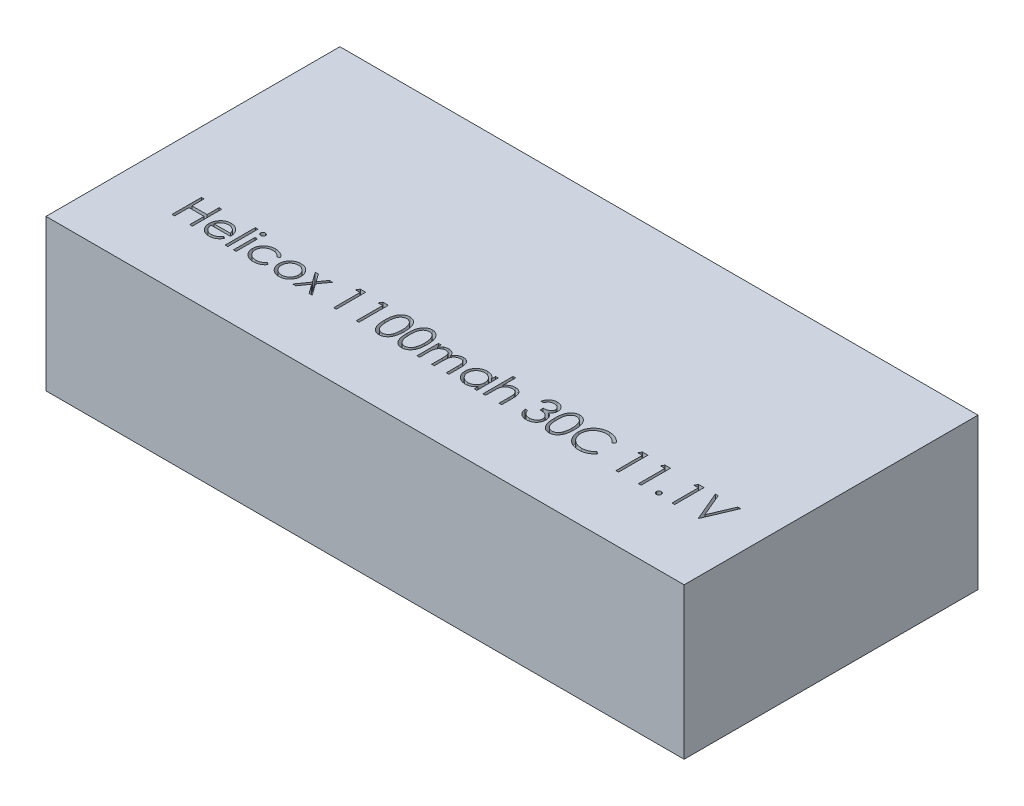
from build123d import *

# Parameters (mm, degrees)
SKETCH1_W           = 76
SKETCH1_H           = 35
BOSS_EXTRUDE1_DEPTH = 18
SKETCH2_W           = 0.314102564
SKETCH2_H           = 3.58974359
SKETCH2_H_2         = 2.557692308
CUT_EXTRUDE1_DEPTH  = 1


with BuildPart() as part:
    # Sketch1 → Boss-Extrude1 (new body)
    with BuildSketch(Plane(origin=(0, 0, 0), x_dir=(1, 0, 0), z_dir=(0, 1, 0))):
        Rectangle(SKETCH1_W, SKETCH1_H)
    extrude(amount=BOSS_EXTRUDE1_DEPTH)

    # Sketch2 → Cut-Extrude1 (cut)
    # profile 1 of 23: a face of its own
    with BuildSketch(Plane(origin=(0, 18, 0), x_dir=(1, 0, 0), z_dir=(0, 1, 0))):
        Polygon((-30.69857497, -6.289149203), (-30.384472406, -6.289149203), (-30.384472406, -7.725046639), (-28.589600611, -7.725046639), (-28.589600611, -6.289149203), (-28.275498047, -6.289149203), (-28.275498047, -9.789149203), (-28.589600611, -9.789149203), (-28.589600611, -8.084020998), (-30.384472406, -8.084020998), (-30.384472406, -9.789149203), (-30.69857497, -9.789149203), align=None)
    # profile 2 of 23: a face of its own
    with BuildSketch(Plane(origin=(0, 18, 0), x_dir=(1, 0, 0), z_dir=(0, 1, 0))):
        with BuildLine():
            Line((-25.368647085, -8.981456895), (-25.089600611, -9.12799135))
            add(Edge.make_bspline(
                [(-25.089600611, -9.12799135), (-25.111837206, -9.167434682), (-25.155100815, -9.244175785), (-25.229501563, -9.349607645), (-25.307493635, -9.444455361), (-25.392597603, -9.526185015), (-25.482267282, -9.5974364), (-25.576999937, -9.659774225), (-25.677288755, -9.712892745), (-25.783138479, -9.757645273), (-25.895438031, -9.792054767), (-26.014459547, -9.816358988), (-26.140431042, -9.831382257), (-26.226777222, -9.833127398), (-26.270990835, -9.834020998)],
                knots=[0, 0, 0, 0, 1.120438281, 2.179929193, 3.190490725, 4.156257408, 5.095198341, 6.022838206, 6.959905092, 7.901321166, 8.864066838, 9.862729781, 10.905609505, 12, 12, 12, 12], degree=3))
            add(Edge.make_bspline(
                [(-26.270990835, -9.834020998), (-26.320132813, -9.832873823), (-26.415994575, -9.830636016), (-26.555534322, -9.811343551), (-26.68691374, -9.779871193), (-26.810125443, -9.735905651), (-26.924867696, -9.678478327), (-27.031368551, -9.608518845), (-27.130188077, -9.526386591), (-27.218212286, -9.431370147), (-27.297456169, -9.32968819), (-27.367381989, -9.223732305), (-27.42583942, -9.113769081), (-27.47339203, -9.000498557), (-27.511796895, -8.884634663), (-27.538563599, -8.765123196), (-27.553993347, -8.642287612), (-27.556357792, -8.559190276), (-27.557549329, -8.517314267)],
                knots=[0, 0, 0, 0, 1.145258523, 2.234067595, 3.276747158, 4.290159414, 5.277019952, 6.260822364, 7.254936242, 8.264827045, 9.274100331, 10.257902744, 11.220704747, 12.172965371, 13.118907548, 14.062713208, 15.023725156, 16, 16, 16, 16], degree=3))
            add(Edge.make_bspline(
                [(-27.557549329, -8.517314267), (-27.556490188, -8.478019437), (-27.554391109, -8.400142272), (-27.541160322, -8.284876728), (-27.517712029, -8.172848275), (-27.485535705, -8.063963827), (-27.443984459, -7.958405693), (-27.39315224, -7.856109629), (-27.332959862, -7.75718449), (-27.286487188, -7.694781356), (-27.263078175, -7.663347921)],
                knots=[0, 0, 0, 0, 1.024358464, 2.0301432, 3.019427413, 4.004406732, 4.986367066, 5.972626655, 6.978780325, 8, 8, 8, 8], degree=3))
            add(Edge.make_bspline(
                [(-27.263078175, -7.663347921), (-27.231370492, -7.625479051), (-27.168959546, -7.5509409), (-27.06340319, -7.453002575), (-26.949102994, -7.370958799), (-26.827491368, -7.302951663), (-26.697154894, -7.251278016), (-26.559845603, -7.212770434), (-26.414000017, -7.191192423), (-26.314294796, -7.188144589), (-26.263278496, -7.1865851)],
                knots=[0, 0, 0, 0, 1.030682036, 2.02871468, 2.997146059, 3.962720338, 4.930598197, 5.918074684, 6.934738563, 8, 8, 8, 8], degree=3))
            add(Edge.make_bspline(
                [(-26.263278496, -7.1865851), (-26.21083089, -7.187939149), (-26.107940644, -7.190595485), (-25.957908523, -7.215221818), (-25.815947807, -7.254274373), (-25.682115303, -7.309428163), (-25.556397442, -7.380587715), (-25.439611392, -7.468729556), (-25.32975988, -7.571147644), (-25.265851301, -7.649910853), (-25.233330579, -7.689990549)],
                knots=[0, 0, 0, 0, 1.056321875, 2.072262726, 3.055038591, 4.01806755, 4.982017516, 5.957941055, 6.960871419, 8, 8, 8, 8], degree=3))
            add(Edge.make_bspline(
                [(-25.233330579, -7.689990549), (-25.211203641, -7.720194131), (-25.167097048, -7.780400249), (-25.111849948, -7.878571406), (-25.063892553, -7.981282001), (-25.025559592, -8.090192298), (-24.99452009, -8.204011878), (-24.972063272, -8.323554423), (-24.958893653, -8.448784334), (-24.956304956, -8.53411089), (-24.954985226, -8.577610741)],
                knots=[0, 0, 0, 0, 0.94817472, 1.890038105, 2.849395472, 3.817997239, 4.812318967, 5.836947057, 6.897266129, 8, 8, 8, 8], degree=3))
            Line((-24.954985226, -8.577610741), (-27.243446765, -8.577610741))
            add(Edge.make_bspline(
                [(-27.243446765, -8.577610741), (-27.241907158, -8.611311206), (-27.238879585, -8.677581809), (-27.224764441, -8.774552593), (-27.202515668, -8.866925935), (-27.171246605, -8.954008977), (-27.13337976, -9.036939104), (-27.086994043, -9.115101141), (-27.031654489, -9.188139071), (-26.96992879, -9.256706209), (-26.901221694, -9.31776697), (-26.828938947, -9.372418746), (-26.752045382, -9.418224343), (-26.671147299, -9.455404233), (-26.586375513, -9.484510549), (-26.497703318, -9.504378369), (-26.405305202, -9.517685476), (-26.342319468, -9.519165142), (-26.310253656, -9.519918434)],
                knots=[0, 0, 0, 0, 1.094153842, 2.151609401, 3.174256925, 4.172055639, 5.149267565, 6.128595816, 7.11444997, 8.118368179, 9.117203808, 10.09244225, 11.054858984, 12.015122123, 12.976791628, 13.957293641, 14.960065497, 16, 16, 16, 16], degree=3))
            add(Edge.make_bspline(
                [(-26.310253656, -9.519918434), (-26.278902508, -9.519310377), (-26.216695817, -9.518103876), (-26.12405496, -9.506371965), (-26.032915433, -9.48740169), (-25.943654449, -9.461511699), (-25.858083603, -9.429934847), (-25.778838053, -9.39183199), (-25.705957838, -9.349682243), (-25.637840871, -9.301472568), (-25.571769878, -9.242464381), (-25.506227391, -9.16882866), (-25.435950738, -9.081741132), (-25.391961145, -9.016195466), (-25.368647085, -8.981456895)],
                knots=[0, 0, 0, 0, 0.99110716, 1.966546729, 2.947904876, 3.932708344, 4.903319531, 5.828989031, 6.710028674, 7.56322171, 8.463672341, 9.504779593, 10.677557249, 12, 12, 12, 12], degree=3))
        make_face()
        with BuildLine():
            add(Edge.make_bspline(
                [(-25.269087791, -8.263508177), (-25.280584415, -8.221845304), (-25.302711717, -8.141657683), (-25.348948081, -8.030616793), (-25.401019622, -7.931928892), (-25.462641353, -7.846349259), (-25.532460079, -7.770345746), (-25.613105261, -7.70392716), (-25.703541155, -7.644509709), (-25.803300296, -7.59435721), (-25.908942081, -7.551667351), (-26.019548273, -7.523042235), (-26.13240606, -7.503432693), (-26.208740347, -7.501606585), (-26.247152694, -7.500687665)],
                knots=[0, 0, 0, 0, 1.154881502, 2.222775134, 3.210006277, 4.132804581, 5.035138423, 5.962687519, 6.919655026, 7.923214229, 8.944639381, 9.960483929, 10.97369054, 12, 12, 12, 12], degree=3))
            add(Edge.make_bspline(
                [(-26.247152694, -7.500687665), (-26.278502133, -7.501299336), (-26.340473382, -7.502508482), (-26.43177445, -7.513978611), (-26.519454149, -7.532938456), (-26.604159437, -7.558903413), (-26.684780305, -7.593512015), (-26.762975073, -7.634095242), (-26.83675547, -7.683636826), (-26.882896765, -7.721395681), (-26.906207182, -7.740471318)],
                knots=[0, 0, 0, 0, 1.04873581, 2.073130211, 3.073294108, 4.04793562, 5.032784715, 6.005352987, 6.992311501, 8, 8, 8, 8], degree=3))
            add(Edge.make_bspline(
                [(-26.906207182, -7.740471318), (-26.922900464, -7.755565634), (-26.956683598, -7.78611285), (-27.001824119, -7.838742057), (-27.045044592, -7.895493619), (-27.084378245, -7.958538743), (-27.120455831, -8.027159522), (-27.154215808, -8.100777158), (-27.18460222, -8.179950288), (-27.20169833, -8.235122727), (-27.210494041, -8.263508177)],
                knots=[0, 0, 0, 0, 0.879870761, 1.780643979, 2.707998968, 3.669668524, 4.684282772, 5.740141944, 6.837334558, 8, 8, 8, 8], degree=3))
            Line((-27.210494041, -8.263508177), (-25.269087791, -8.263508177))
        make_face(mode=Mode.SUBTRACT)
    # profile 3 of 23: a face of its own
    with BuildSketch(Plane(origin=(0, 18, 0), x_dir=(1, 0, 0), z_dir=(0, 1, 0))):
        with Locations((-24.214600611, -7.994277408)):
            Rectangle(SKETCH2_W, SKETCH2_H)
    # profile 4 of 23: a face of its own
    with BuildSketch(Plane(origin=(0, 18, 0), x_dir=(1, 0, 0), z_dir=(0, 1, 0))):
        with BuildLine():
            add(Edge.make_bspline(
                [(-23.228823367, -6.154533818), (-23.209332052, -6.155437971), (-23.171164312, -6.157208475), (-23.115971044, -6.172369952), (-23.065714032, -6.198069637), (-23.021136299, -6.232549318), (-22.982884413, -6.273098762), (-22.956103702, -6.32035973), (-22.938891306, -6.371418369), (-22.936812751, -6.407033458), (-22.935754457, -6.425166831)],
                knots=[0, 0, 0, 0, 1.055194115, 2.066272739, 3.074728998, 4.095836921, 5.109056067, 6.073838105, 7.019297344, 8, 8, 8, 8], degree=3))
            add(Edge.make_bspline(
                [(-22.935754457, -6.425166831), (-22.936836617, -6.442829484), (-22.938975919, -6.477746459), (-22.956090407, -6.527919931), (-22.983112645, -6.574524215), (-23.021111771, -6.614994925), (-23.065720532, -6.649455545), (-23.115969318, -6.675160284), (-23.171164766, -6.690320421), (-23.209332205, -6.69209111), (-23.228823367, -6.692995357)],
                knots=[0, 0, 0, 0, 0.96129708, 1.900370562, 2.859976407, 3.87933698, 4.906634145, 5.921202961, 6.938410037, 8, 8, 8, 8], degree=3))
            add(Edge.make_bspline(
                [(-23.228823367, -6.692995357), (-23.248091643, -6.692125637), (-23.285594823, -6.69043284), (-23.339961665, -6.674862822), (-23.389790155, -6.649446749), (-23.434454827, -6.615220564), (-23.47168502, -6.574275667), (-23.498783346, -6.527948373), (-23.515858308, -6.477739218), (-23.518002936, -6.442827052), (-23.519087791, -6.425166831)],
                knots=[0, 0, 0, 0, 1.054934014, 2.053291228, 3.073705704, 4.106921865, 5.123545215, 6.088680038, 7.033164197, 8, 8, 8, 8], degree=3))
            add(Edge.make_bspline(
                [(-23.519087791, -6.425166831), (-23.518026704, -6.407035982), (-23.515942663, -6.371425849), (-23.498770547, -6.320330816), (-23.471910739, -6.273349314), (-23.434430175, -6.232323815), (-23.389796715, -6.19807838), (-23.33995997, -6.172667399), (-23.285595271, -6.157096059), (-23.248091795, -6.155403445), (-23.228823367, -6.154533818)],
                knots=[0, 0, 0, 0, 0.98631895, 1.937192651, 2.907499808, 3.917963147, 4.944918757, 5.95915025, 6.951458133, 8, 8, 8, 8], degree=3))
        make_face()
    # profile 5 of 23: a face of its own
    with BuildSketch(Plane(origin=(0, 18, 0), x_dir=(1, 0, 0), z_dir=(0, 1, 0))):
        with Locations((-23.227421124, -8.510303049)):
            Rectangle(SKETCH2_W, SKETCH2_H_2)
    # profile 6 of 23: a face of its own
    with BuildSketch(Plane(origin=(0, 18, 0), x_dir=(1, 0, 0), z_dir=(0, 1, 0))):
        with BuildLine():
            Line((-19.794728816, -7.786044235), (-20.057649489, -7.949405613))
            add(Edge.make_bspline(
                [(-20.057649489, -7.949405613), (-20.086479355, -7.913577219), (-20.14322605, -7.843055109), (-20.241765286, -7.752045176), (-20.3467767, -7.673878134), (-20.460054748, -7.610174383), (-20.581440548, -7.560952933), (-20.710455399, -7.526122727), (-20.847080904, -7.504418484), (-20.940746103, -7.501951648), (-20.988739233, -7.500687665)],
                knots=[0, 0, 0, 0, 1.026593902, 2.0206758, 2.988051866, 3.946915611, 4.916868779, 5.907761954, 6.927957743, 8, 8, 8, 8], degree=3))
            add(Edge.make_bspline(
                [(-20.988739233, -7.500687665), (-21.02709819, -7.501744507), (-21.102645112, -7.503825929), (-21.213551266, -7.516836422), (-21.319193619, -7.54047843), (-21.420234328, -7.571629387), (-21.515954746, -7.613379677), (-21.606605665, -7.664189433), (-21.692991155, -7.723239473), (-21.772607896, -7.791650019), (-21.845436903, -7.866048687), (-21.908535817, -7.945802382), (-21.963472751, -8.028522273), (-22.006578707, -8.116274015), (-22.041853877, -8.207050069), (-22.065060598, -8.302563924), (-22.080525293, -8.401591932), (-22.082294622, -8.469110272), (-22.083190355, -8.503291831)],
                knots=[0, 0, 0, 0, 1.112346261, 2.190735716, 3.231507886, 4.247384806, 5.251966152, 6.253067467, 7.256802811, 8.280671706, 9.291813951, 10.270744147, 11.225547591, 12.165006084, 13.100104208, 14.043489273, 15.009504848, 16, 16, 16, 16], degree=3))
            add(Edge.make_bspline(
                [(-22.083190355, -8.503291831), (-22.081411102, -8.548061042), (-22.077876572, -8.636996238), (-22.050175112, -8.76827434), (-22.004830705, -8.89519803), (-21.942772854, -9.016866167), (-21.86429572, -9.129460323), (-21.772123156, -9.230443777), (-21.666204073, -9.317859805), (-21.547471742, -9.39033233), (-21.418713999, -9.448593698), (-21.281323894, -9.490101031), (-21.136424114, -9.515153403), (-21.037217367, -9.518309346), (-20.986635867, -9.519918434)],
                knots=[0, 0, 0, 0, 0.966302908, 1.919585723, 2.883856336, 3.870342332, 4.860282998, 5.839159637, 6.814385684, 7.815993281, 8.834850808, 9.858348828, 10.908058873, 12, 12, 12, 12], degree=3))
            add(Edge.make_bspline(
                [(-20.986635867, -9.519918434), (-20.940280683, -9.518618937), (-20.849180445, -9.51606508), (-20.71601316, -9.494536116), (-20.589233249, -9.459292483), (-20.468845218, -9.410144833), (-20.355069052, -9.346617317), (-20.248639877, -9.268258146), (-20.147439939, -9.177321546), (-20.087942962, -9.107003574), (-20.057649489, -9.071200485)],
                knots=[0, 0, 0, 0, 1.039848629, 2.043578496, 3.018386758, 3.987534228, 4.954977003, 5.934852016, 6.948509513, 8, 8, 8, 8], degree=3))
            Line((-20.057649489, -9.071200485), (-19.794728816, -9.243676447))
            add(Edge.make_bspline(
                [(-19.794728816, -9.243676447), (-19.810316518, -9.266567174), (-19.841440185, -9.31227265), (-19.893467811, -9.376716767), (-19.949587642, -9.437038449), (-20.009580739, -9.493156839), (-20.072663749, -9.546414858), (-20.140991659, -9.594266433), (-20.21236127, -9.639401256), (-20.287610428, -9.680014128), (-20.365961126, -9.716520449), (-20.447303116, -9.74791162), (-20.531282928, -9.774881726), (-20.617999304, -9.796319073), (-20.707623203, -9.813429911), (-20.799922837, -9.824783613), (-20.894866419, -9.833258894), (-20.95903857, -9.833764761), (-20.99154372, -9.834020998)],
                knots=[0, 0, 0, 0, 0.954134338, 1.905101784, 2.851144739, 3.791306361, 4.734911809, 5.6936923, 6.663572882, 7.643865596, 8.638447847, 9.640600242, 10.646758161, 11.676244097, 12.717260333, 13.78922464, 14.880174919, 16, 16, 16, 16], degree=3))
            add(Edge.make_bspline(
                [(-20.99154372, -9.834020998), (-21.041154604, -9.833129718), (-21.138392296, -9.831382803), (-21.280714803, -9.812174328), (-21.416728471, -9.783216712), (-21.546386829, -9.741652978), (-21.669710063, -9.688148202), (-21.786583181, -9.622791288), (-21.896619199, -9.545039498), (-21.998729982, -9.456276729), (-22.092511428, -9.360036088), (-22.173037619, -9.25618617), (-22.242882889, -9.148545122), (-22.298970432, -9.034735596), (-22.343617359, -8.916270223), (-22.374122191, -8.792199983), (-22.393851929, -8.663547729), (-22.396135308, -8.575814847), (-22.397292919, -8.531336703)],
                knots=[0, 0, 0, 0, 1.1129367, 2.181364009, 3.217532258, 4.231199276, 5.232079859, 6.230262199, 7.231623845, 8.250719726, 9.263571943, 10.242672461, 11.195837495, 12.138959767, 13.085126421, 14.0317438, 15.002148558, 16, 16, 16, 16], degree=3))
            add(Edge.make_bspline(
                [(-22.397292919, -8.531336703), (-22.396851903, -8.501158268), (-22.395974649, -8.441128381), (-22.385912721, -8.352033314), (-22.372914248, -8.264124769), (-22.350888511, -8.17851705), (-22.325447879, -8.09391176), (-22.292972348, -8.011328658), (-22.254876953, -7.930383986), (-22.211625005, -7.851286256), (-22.16293626, -7.775336716), (-22.109055027, -7.703583052), (-22.052010691, -7.635163286), (-21.989134579, -7.572439526), (-21.923094925, -7.512903334), (-21.852023349, -7.45814521), (-21.776327497, -7.408004219), (-21.697144175, -7.361553204), (-21.614519464, -7.320193769), (-21.528952793, -7.284560531), (-21.440959764, -7.254107955), (-21.35039962, -7.229999036), (-21.257873447, -7.209781612), (-21.162652109, -7.197063766), (-21.065099886, -7.188077493), (-20.999043864, -7.187086701), (-20.965602214, -7.1865851)],
                knots=[0, 0, 0, 0, 0.990994727, 1.971252077, 2.943264845, 3.907940874, 4.872158414, 5.844625996, 6.82015047, 7.809835459, 8.804511986, 9.781214284, 10.756496977, 11.728388426, 12.696359165, 13.676225489, 14.672885716, 15.677705647, 16.690706858, 17.706033469, 18.721040654, 19.747369689, 20.783475414, 21.830280724, 22.901553713, 24, 24, 24, 24], degree=3))
            add(Edge.make_bspline(
                [(-20.965602214, -7.1865851), (-20.923722106, -7.187506992), (-20.840171226, -7.189346166), (-20.716230519, -7.204824818), (-20.594115325, -7.228161234), (-20.475968222, -7.262734064), (-20.363221707, -7.30459772), (-20.257686257, -7.351610434), (-20.161846153, -7.406205038), (-20.073918564, -7.465925152), (-19.993739047, -7.533286058), (-19.920484554, -7.609093015), (-19.852652905, -7.692951494), (-19.814196194, -7.754757225), (-19.794728816, -7.786044235)],
                knots=[0, 0, 0, 0, 1.095225653, 2.184976855, 3.262915854, 4.344593502, 5.400796181, 6.407717688, 7.363229445, 8.282371371, 9.184954523, 10.097238608, 11.036792983, 12, 12, 12, 12], degree=3))
        make_face()
    # profile 7 of 23: a face of its own
    with BuildSketch(Plane(origin=(0, 18, 0), x_dir=(1, 0, 0), z_dir=(0, 1, 0))):
        with BuildLine():
            add(Edge.make_bspline(
                [(-17.931147085, -7.1865851), (-17.883155813, -7.187606992), (-17.789056655, -7.18961067), (-17.651248769, -7.211025636), (-17.519703633, -7.243773), (-17.393917441, -7.289044563), (-17.275501146, -7.349726513), (-17.162729901, -7.422135804), (-17.055912893, -7.507918398), (-16.991889863, -7.574276466), (-16.959392278, -7.607959299)],
                knots=[0, 0, 0, 0, 1.054011418, 2.066658804, 3.057071809, 4.030435133, 4.997543892, 5.974964718, 6.972108034, 8, 8, 8, 8], degree=3))
            add(Edge.make_bspline(
                [(-16.959392278, -7.607959299), (-16.931410324, -7.640173285), (-16.875987943, -7.703977827), (-16.804922225, -7.80743344), (-16.743700664, -7.914573541), (-16.694637703, -8.026820867), (-16.65595268, -8.143195539), (-16.628486984, -8.26409755), (-16.612150049, -8.389259897), (-16.609947082, -8.474263735), (-16.60883138, -8.517314267)],
                knots=[0, 0, 0, 0, 1.025258237, 2.030674902, 3.01204498, 3.988269485, 4.97094183, 5.956517959, 6.965070386, 8, 8, 8, 8], degree=3))
            add(Edge.make_bspline(
                [(-16.60883138, -8.517314267), (-16.609812718, -8.560614325), (-16.611751886, -8.646177258), (-16.630095502, -8.772196624), (-16.658626588, -8.894391447), (-16.699458426, -9.01225014), (-16.751816536, -9.126132968), (-16.815707223, -9.235542517), (-16.89157884, -9.34069465), (-16.977582837, -9.440696489), (-17.072634713, -9.532862703), (-17.175750862, -9.613190973), (-17.284904895, -9.682012497), (-17.401548249, -9.737448913), (-17.524615735, -9.781158613), (-17.654372803, -9.81185863), (-17.790617874, -9.830420313), (-17.883645095, -9.832803887), (-17.931147085, -9.834020998)],
                knots=[0, 0, 0, 0, 0.998656419, 1.973391657, 2.932242238, 3.890759089, 4.846373663, 5.82037756, 6.809684879, 7.83454468, 8.860553229, 9.859544525, 10.845671541, 11.83227036, 12.833544569, 13.85385346, 14.904124723, 16, 16, 16, 16], degree=3))
            add(Edge.make_bspline(
                [(-17.931147085, -9.834020998), (-17.978881805, -9.832799802), (-18.072372665, -9.830408027), (-18.209098647, -9.811930744), (-18.339088265, -9.781172762), (-18.462316864, -9.737305269), (-18.579461711, -9.682010725), (-18.689248208, -9.613399036), (-18.792448123, -9.532838881), (-18.887520108, -9.440702944), (-18.973518713, -9.340692987), (-19.049391722, -9.235542949), (-19.113282048, -9.126132855), (-19.165640252, -9.01225017), (-19.206472064, -8.894391439), (-19.235003157, -8.772196626), (-19.253346772, -8.646177258), (-19.25528594, -8.560614325), (-19.256267278, -8.517314267)],
                knots=[0, 0, 0, 0, 1.099876186, 2.154163076, 3.173186993, 4.173200201, 5.163417411, 6.152872554, 7.150605724, 8.17532212, 9.198891216, 10.186952605, 11.159729845, 12.11414092, 13.071450619, 14.029093627, 15.002601286, 16, 16, 16, 16], degree=3))
            add(Edge.make_bspline(
                [(-19.256267278, -8.517314267), (-19.255143967, -8.474497721), (-19.252920006, -8.389728319), (-19.236599497, -8.264801258), (-19.20924094, -8.144103869), (-19.170509544, -8.028178393), (-19.120994353, -7.916422957), (-19.060633065, -7.809018126), (-18.988842433, -7.706030326), (-18.933640481, -7.642308246), (-18.90570638, -7.610062665)],
                knots=[0, 0, 0, 0, 1.031353054, 2.041901799, 3.029428768, 4.008703097, 4.981709435, 5.96992636, 6.972712378, 8, 8, 8, 8], degree=3))
            add(Edge.make_bspline(
                [(-18.90570638, -7.610062665), (-18.873257789, -7.576087725), (-18.809441925, -7.509270029), (-18.702093198, -7.423737505), (-18.589599377, -7.349821431), (-18.46987445, -7.290345216), (-18.344191592, -7.243506698), (-18.21197235, -7.210941183), (-18.073696834, -7.189687828), (-17.979137213, -7.18762965), (-17.931147085, -7.1865851)],
                knots=[0, 0, 0, 0, 1.027980169, 2.021703884, 2.998553061, 3.971491411, 4.943284454, 5.930300938, 6.949603206, 8, 8, 8, 8], degree=3))
        make_face()
        with BuildLine():
            add(Edge.make_bspline(
                [(-17.932549329, -7.500687665), (-17.96648694, -7.501652256), (-18.033486069, -7.503556539), (-18.132105654, -7.518040444), (-18.227045808, -7.540987948), (-18.318486652, -7.573592004), (-18.406119824, -7.615690903), (-18.490029227, -7.667399263), (-18.570461666, -7.728032219), (-18.64584373, -7.797494891), (-18.715026042, -7.873373886), (-18.775504019, -7.954222244), (-18.826929125, -8.038728591), (-18.869769284, -8.126980802), (-18.901676472, -8.219873216), (-18.924849494, -8.316353847), (-18.939319735, -8.416619264), (-18.941206114, -8.484780282), (-18.942164714, -8.519417633)],
                knots=[0, 0, 0, 0, 1.021534396, 2.016698045, 2.994645724, 3.958388632, 4.93408049, 5.916473867, 6.921342795, 7.962252576, 8.998418191, 10.008913653, 10.997312074, 11.973003931, 12.956656626, 13.948281152, 14.957379055, 16, 16, 16, 16], degree=3))
            add(Edge.make_bspline(
                [(-18.942164714, -8.519417633), (-18.94055789, -8.56416966), (-18.937368646, -8.652994065), (-18.911433409, -8.783805188), (-18.868047129, -8.90938704), (-18.809459849, -9.029003426), (-18.736053631, -9.139675704), (-18.649566564, -9.238347188), (-18.550926864, -9.323533), (-18.441310364, -9.394213845), (-18.322956046, -9.450373601), (-18.197699725, -9.490172577), (-18.067059031, -9.516044269), (-17.977778299, -9.518615744), (-17.932549329, -9.519918434)],
                knots=[0, 0, 0, 0, 1.016792936, 2.018143844, 3.017858371, 4.030088057, 5.03801393, 6.028138512, 7.003788237, 7.991172063, 8.984598303, 9.972568034, 10.972917682, 12, 12, 12, 12], degree=3))
            add(Edge.make_bspline(
                [(-17.932549329, -9.519918434), (-17.88732296, -9.518608154), (-17.798047364, -9.516021697), (-17.667588187, -9.490302877), (-17.542674215, -9.450199216), (-17.424442828, -9.394277006), (-17.314876224, -9.323264592), (-17.215527103, -9.238828215), (-17.129778492, -9.139414363), (-17.056444887, -9.028856834), (-16.996898144, -8.909572482), (-16.953714943, -8.78378201), (-16.927717357, -8.652999968), (-16.924536528, -8.564171637), (-16.922933944, -8.519417633)],
                knots=[0, 0, 0, 0, 1.02726834, 2.027799167, 3.010890988, 4.004497153, 4.992059811, 5.971914811, 6.958719428, 7.966827853, 8.981595046, 9.981490638, 10.983022906, 12, 12, 12, 12], degree=3))
            add(Edge.make_bspline(
                [(-16.922933944, -8.519417633), (-16.923892214, -8.484780075), (-16.925777944, -8.416618649), (-16.940252908, -8.316356196), (-16.963408448, -8.219864599), (-16.995380065, -8.127012596), (-17.038034079, -8.038500091), (-17.090450872, -7.954470364), (-17.150681897, -7.873093818), (-17.220699018, -7.797740177), (-17.296002396, -7.728005141), (-17.376467434, -7.667375751), (-17.460252413, -7.615918156), (-17.547630995, -7.573231915), (-17.639083563, -7.541284575), (-17.733890692, -7.517907944), (-17.832089502, -7.503617747), (-17.898848545, -7.501670605), (-17.932549329, -7.500687665)],
                knots=[0, 0, 0, 0, 1.042956736, 2.052379634, 3.044323526, 4.02829302, 5.004299113, 5.996692471, 7.007513377, 8.048758398, 9.090003419, 10.095195979, 11.07790575, 12.047570684, 13.018257071, 13.989683339, 14.985167495, 16, 16, 16, 16], degree=3))
        make_face(mode=Mode.SUBTRACT)
    # profile 8 of 23: a face of its own
    with BuildSketch(Plane(origin=(0, 18, 0), x_dir=(1, 0, 0), z_dir=(0, 1, 0))):
        Polygon((-16.204985226, -7.231456895), (-15.83128731, -7.231456895), (-15.172933944, -8.154133177), (-14.514580579, -7.231456895), (-14.140882662, -7.231456895), (-14.985734425, -8.415651607), (-14.006267278, -9.789149203), (-14.379965194, -9.789149203), (-15.172933944, -8.677871158), (-15.965902694, -9.789149203), (-16.339600611, -9.789149203), (-15.359432342, -8.415651607), align=None)
    # profile 9 of 23: a face of its own
    with BuildSketch(Plane(origin=(0, 18, 0), x_dir=(1, 0, 0), z_dir=(0, 1, 0))):
        Polygon((-11.781607823, -6.289149203), (-11.134472406, -6.289149203), (-11.134472406, -9.789149203), (-11.44857497, -9.789149203), (-11.44857497, -6.648123562), (-11.987036508, -6.648123562), align=None)
    # profile 10 of 23: a face of its own
    with BuildSketch(Plane(origin=(0, 18, 0), x_dir=(1, 0, 0), z_dir=(0, 1, 0))):
        Polygon((-9.08930013, -6.289149203), (-8.442164714, -6.289149203), (-8.442164714, -9.789149203), (-8.756267278, -9.789149203), (-8.756267278, -6.648123562), (-9.294728816, -6.648123562), align=None)
    # profile 11 of 23: a face of its own
    with BuildSketch(Plane(origin=(0, 18, 0), x_dir=(1, 0, 0), z_dir=(0, 1, 0))):
        with BuildLine():
            add(Edge.make_bspline(
                [(-7.140882662, -8.040551447), (-7.140554644, -7.984454059), (-7.139917464, -7.875484075), (-7.132829043, -7.716699433), (-7.121053701, -7.567739144), (-7.104916328, -7.428596078), (-7.085278348, -7.299234313), (-7.059062861, -7.179999556), (-7.029250059, -7.070339949), (-6.994697613, -6.969897901), (-6.955709824, -6.877320198), (-6.913275563, -6.790894996), (-6.865710769, -6.710753064), (-6.815733856, -6.635615274), (-6.761321784, -6.566711579), (-6.704022994, -6.503068916), (-6.641601117, -6.446158166), (-6.576178109, -6.394311864), (-6.507161645, -6.348862392), (-6.436518979, -6.308829653), (-6.363763873, -6.274629786), (-6.28869769, -6.24773935), (-6.211995132, -6.225528503), (-6.133388065, -6.210339556), (-6.052746701, -6.200782647), (-5.998315266, -6.19986898), (-5.970710387, -6.199405613)],
                knots=[0, 0, 0, 0, 1.646270934, 3.197905019, 4.663502075, 6.030701355, 7.308322542, 8.50163776, 9.611534131, 10.641858119, 11.616356847, 12.558055219, 13.465016945, 14.349605745, 15.204443733, 16.039544428, 16.859896111, 17.680448484, 18.487036065, 19.28249412, 20.06191084, 20.843045899, 21.620316918, 22.403196591, 23.190181807, 24, 24, 24, 24], degree=3))
            add(Edge.make_bspline(
                [(-5.970710387, -6.199405613), (-5.942874908, -6.199893428), (-5.887518899, -6.200863539), (-5.805678524, -6.210187482), (-5.725728842, -6.225658605), (-5.648010704, -6.24757958), (-5.571885717, -6.274775256), (-5.49794931, -6.308862373), (-5.425742228, -6.348541241), (-5.35641194, -6.395165118), (-5.289197325, -6.447147394), (-5.225749362, -6.505910063), (-5.166062276, -6.570859782), (-5.109386971, -6.641301646), (-5.057331374, -6.718586731), (-5.007757941, -6.801370841), (-4.963385905, -6.891101706), (-4.92065123, -6.986282173), (-4.883764244, -7.089545832), (-4.850497998, -7.200310593), (-4.82361903, -7.31988478), (-4.801229757, -7.447641025), (-4.783884861, -7.584048508), (-4.771252219, -7.728814824), (-4.764579134, -7.882035214), (-4.763322433, -7.986793063), (-4.762677534, -8.040551447)],
                knots=[0, 0, 0, 0, 0.810914788, 1.612654377, 2.396697861, 3.181598691, 3.963628158, 4.749916497, 5.551656086, 6.361998678, 7.18212741, 8.025565596, 8.878627764, 9.750805457, 10.657531673, 11.591944965, 12.560506719, 13.57287815, 14.630710178, 15.753379473, 16.941251878, 18.199788006, 19.531962791, 20.947069417, 22.433333509, 24, 24, 24, 24], degree=3))
            add(Edge.make_bspline(
                [(-4.762677534, -8.040551447), (-4.763329119, -8.094075355), (-4.764598705, -8.198364506), (-4.771177411, -8.350895482), (-4.784136043, -8.494893525), (-4.800346031, -8.630703987), (-4.822796994, -8.757761606), (-4.85040216, -8.876506055), (-4.881052483, -8.987450126), (-4.918887277, -9.089684938), (-4.960297987, -9.184636661), (-5.005353184, -9.273303809), (-5.05362301, -9.356470102), (-5.106211755, -9.433469849), (-5.162265168, -9.504848506), (-5.222982957, -9.569346129), (-5.286653542, -9.628516801), (-5.354065958, -9.681168428), (-5.424477509, -9.727253233), (-5.496436586, -9.768467083), (-5.571219969, -9.801699778), (-5.647132922, -9.830234819), (-5.725261288, -9.852035271), (-5.805507679, -9.867109126), (-5.887463914, -9.877680975), (-5.94286548, -9.878487455), (-5.970710387, -9.878892793)],
                knots=[0, 0, 0, 0, 1.561518951, 3.042555995, 4.452378317, 5.7783523, 7.031515105, 8.214008947, 9.334062868, 10.386615937, 11.391082383, 12.354592575, 13.286541444, 14.194233754, 15.072674879, 15.931287219, 16.775624067, 17.606195743, 18.42308326, 19.229000347, 20.022332153, 20.807536673, 21.593273796, 22.3848459, 23.188221202, 24, 24, 24, 24], degree=3))
            add(Edge.make_bspline(
                [(-5.970710387, -9.878892793), (-5.998314501, -9.878426437), (-6.052744425, -9.877506875), (-6.133396851, -9.867993144), (-6.211679294, -9.852697641), (-6.287978048, -9.831281037), (-6.362684563, -9.8050662), (-6.43478085, -9.770912517), (-6.505068534, -9.731578448), (-6.57336009, -9.686783026), (-6.638372251, -9.635461343), (-6.700470856, -9.578697054), (-6.758095875, -9.515073643), (-6.811729971, -9.44559572), (-6.862704059, -9.370902478), (-6.909593432, -9.289974105), (-6.952964286, -9.203131494), (-6.992607777, -9.109813584), (-7.027756441, -9.008658656), (-7.058804149, -8.898509477), (-7.083318306, -8.778393841), (-7.104301262, -8.649276474), (-7.121225645, -8.510602544), (-7.13277997, -8.362296765), (-7.139921285, -8.204451556), (-7.140556355, -8.096181782), (-7.140882662, -8.040551447)],
                knots=[0, 0, 0, 0, 0.810891512, 1.598919785, 2.382837074, 3.152667961, 3.926044502, 4.706494248, 5.493654104, 6.291793342, 7.103789334, 7.925228297, 8.761435821, 9.622817696, 10.50288917, 11.416980706, 12.369136599, 13.353924996, 14.394355917, 15.514179734, 16.714354668, 17.994756427, 19.357759367, 20.818452758, 22.365282078, 24, 24, 24, 24], degree=3))
        make_face()
        with BuildLine():
            add(Edge.make_bspline(
                [(-6.826780098, -8.039149203), (-6.826660651, -8.085897902), (-6.826428828, -8.176627947), (-6.820372627, -8.308471208), (-6.812122395, -8.431441536), (-6.801481098, -8.545695073), (-6.78567815, -8.650845085), (-6.767971362, -8.747614768), (-6.746423272, -8.835492006), (-6.720928254, -8.915079816), (-6.691889157, -8.987728885), (-6.660183294, -9.0553301), (-6.626122571, -9.118682036), (-6.58800342, -9.177215645), (-6.546488357, -9.231121809), (-6.502515098, -9.281354641), (-6.454442514, -9.326151622), (-6.387938771, -9.379878477), (-6.300142297, -9.435397611), (-6.189521841, -9.483743701), (-6.07585339, -9.514126157), (-5.99870214, -9.517989913), (-5.96019356, -9.519918434)],
                knots=[0, 0, 0, 0, 1.459021318, 2.831673884, 4.118529203, 5.306027144, 6.411944654, 7.436330062, 8.375795394, 9.233974572, 10.042671642, 10.816086306, 11.563610507, 12.285937304, 12.993564865, 13.685989202, 14.367179055, 15.041617293, 16.353048772, 17.594441528, 18.799311195, 20, 20, 20, 20], degree=3))
            add(Edge.make_bspline(
                [(-5.96019356, -9.519918434), (-5.921435888, -9.518320653), (-5.844000565, -9.51512839), (-5.73086677, -9.484329653), (-5.6210365, -9.437860113), (-5.534964559, -9.382912608), (-5.469482016, -9.330584278), (-5.422565026, -9.28596963), (-5.379502977, -9.236013763), (-5.338660903, -9.182114467), (-5.301201827, -9.123241983), (-5.267138689, -9.059679408), (-5.236055342, -8.99125023), (-5.218346296, -8.94348049), (-5.209292117, -8.919057056)],
                knots=[0, 0, 0, 0, 1.353760809, 2.704726607, 4.075137775, 5.516104923, 6.260822281, 7.007110065, 7.778089737, 8.566572457, 9.372053459, 10.217411131, 11.088608312, 12, 12, 12, 12], degree=3))
            add(Edge.make_bspline(
                [(-5.209292117, -8.919057056), (-5.19874035, -8.887827316), (-5.177315736, -8.824417552), (-5.149703962, -8.7260539), (-5.127958562, -8.622851136), (-5.108395197, -8.515426019), (-5.095042141, -8.402986318), (-5.084294327, -8.285879934), (-5.07796364, -8.164018572), (-5.077178889, -8.081223581), (-5.076780098, -8.039149203)],
                knots=[0, 0, 0, 0, 0.884706709, 1.796334032, 2.740027952, 3.714592787, 4.726048262, 5.777819803, 6.87074269, 8, 8, 8, 8], degree=3))
            add(Edge.make_bspline(
                [(-5.076780098, -8.039149203), (-5.077330287, -7.997081631), (-5.078406575, -7.914788466), (-5.082520563, -7.794270285), (-5.093144137, -7.679802524), (-5.104943256, -7.570892051), (-5.122340477, -7.468141749), (-5.141098284, -7.370691444), (-5.166299497, -7.279748419), (-5.193219272, -7.193888837), (-5.224029667, -7.114088183), (-5.257945401, -7.039974396), (-5.29416716, -6.971189671), (-5.333509401, -6.90792273), (-5.375505084, -6.849890187), (-5.421262633, -6.798255592), (-5.468967006, -6.751418624), (-5.535784191, -6.697956055), (-5.623258481, -6.64344436), (-5.732104129, -6.5932786), (-5.845374773, -6.564470307), (-5.921948227, -6.56040862), (-5.96019356, -6.558379972)],
                knots=[0, 0, 0, 0, 1.31362396, 2.569729283, 3.763502607, 4.902122613, 5.988968491, 7.01645872, 7.998833611, 8.933434873, 9.825090667, 10.667526885, 11.477055099, 12.250526234, 12.991942729, 13.710640831, 14.402115721, 15.076753259, 16.378508321, 17.609869233, 18.806226677, 20, 20, 20, 20], degree=3))
            add(Edge.make_bspline(
                [(-5.96019356, -6.558379972), (-5.998904152, -6.560411419), (-6.076395857, -6.564478013), (-6.190843812, -6.593171267), (-6.300548164, -6.643184233), (-6.387791139, -6.698136605), (-6.454654925, -6.750474916), (-6.501737618, -6.795861371), (-6.545883791, -6.845507625), (-6.586551491, -6.89990954), (-6.624640774, -6.958374907), (-6.659621787, -7.021363672), (-6.691139116, -7.089195036), (-6.720223652, -7.161811471), (-6.74579644, -7.241392416), (-6.766890404, -7.329161409), (-6.786377457, -7.425623301), (-6.800172726, -7.531342809), (-6.812436481, -7.645624963), (-6.820317829, -7.768902281), (-6.826449087, -7.900966661), (-6.826667551, -7.99216582), (-6.826780098, -8.039149203)],
                knots=[0, 0, 0, 0, 1.207732386, 2.417664972, 3.655092373, 4.956220595, 5.625982001, 6.301752483, 6.994047911, 7.697131622, 8.419323945, 9.170223765, 9.943494443, 10.752040957, 11.610060368, 12.549350801, 13.567764191, 14.679664412, 15.874934091, 17.154273443, 18.533957287, 20, 20, 20, 20], degree=3))
        make_face(mode=Mode.SUBTRACT)
    # profile 12 of 23: a face of its own
    with BuildSketch(Plane(origin=(0, 18, 0), x_dir=(1, 0, 0), z_dir=(0, 1, 0))):
        with BuildLine():
            add(Edge.make_bspline(
                [(-4.44857497, -8.040551447), (-4.448246952, -7.984454059), (-4.447609772, -7.875484075), (-4.440521351, -7.716699433), (-4.428746009, -7.567739144), (-4.412608636, -7.428596078), (-4.392970656, -7.299234313), (-4.366755169, -7.179999556), (-4.336942366, -7.070339949), (-4.302389921, -6.969897901), (-4.263402131, -6.877320198), (-4.220967871, -6.790894996), (-4.173403076, -6.710753064), (-4.123426163, -6.635615274), (-4.069014092, -6.566711579), (-4.011715301, -6.503068916), (-3.949293425, -6.446158166), (-3.883870417, -6.394311864), (-3.814853952, -6.348862392), (-3.744211286, -6.308829653), (-3.67145618, -6.274629786), (-3.596389997, -6.24773935), (-3.51968744, -6.225528503), (-3.441080373, -6.210339556), (-3.360439009, -6.200782647), (-3.306007574, -6.19986898), (-3.278402694, -6.199405613)],
                knots=[0, 0, 0, 0, 1.646270934, 3.197905019, 4.663502075, 6.030701355, 7.308322542, 8.50163776, 9.611534131, 10.641858119, 11.616356847, 12.558055219, 13.465016945, 14.349605745, 15.204443733, 16.039544428, 16.859896111, 17.680448484, 18.487036065, 19.28249412, 20.06191084, 20.843045899, 21.620316918, 22.403196591, 23.190181807, 24, 24, 24, 24], degree=3))
            add(Edge.make_bspline(
                [(-3.278402694, -6.199405613), (-3.250567216, -6.199893428), (-3.195211207, -6.200863539), (-3.113370832, -6.210187482), (-3.03342115, -6.225658605), (-2.955703011, -6.24757958), (-2.879578025, -6.274775256), (-2.805641617, -6.308862373), (-2.733434536, -6.348541241), (-2.664104248, -6.395165118), (-2.596889633, -6.447147394), (-2.53344167, -6.505910063), (-2.473754584, -6.570859782), (-2.417079278, -6.641301646), (-2.365023681, -6.718586731), (-2.315450249, -6.801370841), (-2.271078213, -6.891101706), (-2.228343538, -6.986282173), (-2.191456551, -7.089545832), (-2.158190306, -7.200310593), (-2.131311337, -7.31988478), (-2.108922065, -7.447641025), (-2.091577169, -7.584048508), (-2.078944527, -7.728814824), (-2.072271442, -7.882035214), (-2.071014741, -7.986793063), (-2.070369842, -8.040551447)],
                knots=[0, 0, 0, 0, 0.810914788, 1.612654377, 2.396697861, 3.181598691, 3.963628158, 4.749916497, 5.551656086, 6.361998678, 7.18212741, 8.025565596, 8.878627764, 9.750805457, 10.657531673, 11.591944965, 12.560506719, 13.57287815, 14.630710178, 15.753379473, 16.941251878, 18.199788006, 19.531962791, 20.947069417, 22.433333509, 24, 24, 24, 24], degree=3))
            add(Edge.make_bspline(
                [(-2.070369842, -8.040551447), (-2.071021426, -8.094075355), (-2.072291012, -8.198364506), (-2.078869719, -8.350895482), (-2.09182835, -8.494893525), (-2.108038339, -8.630703987), (-2.130489302, -8.757761606), (-2.158094468, -8.876506055), (-2.188744791, -8.987450126), (-2.226579585, -9.089684938), (-2.267990295, -9.184636661), (-2.313045491, -9.273303809), (-2.361315317, -9.356470102), (-2.413904062, -9.433469849), (-2.469957475, -9.504848506), (-2.530675264, -9.569346129), (-2.594345849, -9.628516801), (-2.661758265, -9.681168428), (-2.732169816, -9.727253233), (-2.804128893, -9.768467083), (-2.878912277, -9.801699778), (-2.954825229, -9.830234819), (-3.032953596, -9.852035271), (-3.113199986, -9.867109126), (-3.195156222, -9.877680975), (-3.250557787, -9.878487455), (-3.278402694, -9.878892793)],
                knots=[0, 0, 0, 0, 1.561518951, 3.042555995, 4.452378317, 5.7783523, 7.031515105, 8.214008947, 9.334062868, 10.386615937, 11.391082383, 12.354592575, 13.286541444, 14.194233754, 15.072674879, 15.931287219, 16.775624067, 17.606195743, 18.42308326, 19.229000347, 20.022332153, 20.807536673, 21.593273796, 22.3848459, 23.188221202, 24, 24, 24, 24], degree=3))
            add(Edge.make_bspline(
                [(-3.278402694, -9.878892793), (-3.306006808, -9.878426437), (-3.360436733, -9.877506875), (-3.441089159, -9.867993144), (-3.519371602, -9.852697641), (-3.595670356, -9.831281037), (-3.670376871, -9.8050662), (-3.742473158, -9.770912517), (-3.812760841, -9.731578448), (-3.881052397, -9.686783026), (-3.946064559, -9.635461343), (-4.008163164, -9.578697054), (-4.065788183, -9.515073643), (-4.119422279, -9.44559572), (-4.170396367, -9.370902478), (-4.21728574, -9.289974105), (-4.260656594, -9.203131494), (-4.300300085, -9.109813584), (-4.335448748, -9.008658656), (-4.366496456, -8.898509477), (-4.391010614, -8.778393841), (-4.411993569, -8.649276474), (-4.428917952, -8.510602544), (-4.440472278, -8.362296765), (-4.447613593, -8.204451556), (-4.448248663, -8.096181782), (-4.44857497, -8.040551447)],
                knots=[0, 0, 0, 0, 0.810891512, 1.598919785, 2.382837074, 3.152667961, 3.926044502, 4.706494248, 5.493654104, 6.291793342, 7.103789334, 7.925228297, 8.761435821, 9.622817696, 10.50288917, 11.416980706, 12.369136599, 13.353924996, 14.394355917, 15.514179734, 16.714354668, 17.994756427, 19.357759367, 20.818452758, 22.365282078, 24, 24, 24, 24], degree=3))
        make_face()
        with BuildLine():
            add(Edge.make_bspline(
                [(-4.134472406, -8.039149203), (-4.134352959, -8.085897902), (-4.134121136, -8.176627947), (-4.128064935, -8.308471208), (-4.119814703, -8.431441536), (-4.109173406, -8.545695073), (-4.093370457, -8.650845085), (-4.075663669, -8.747614768), (-4.05411558, -8.835492006), (-4.028620562, -8.915079816), (-3.999581465, -8.987728885), (-3.967875601, -9.0553301), (-3.933814878, -9.118682036), (-3.895695728, -9.177215645), (-3.854180665, -9.231121809), (-3.810207406, -9.281354641), (-3.762134821, -9.326151622), (-3.695631079, -9.379878477), (-3.607834604, -9.435397611), (-3.497214149, -9.483743701), (-3.383545698, -9.514126157), (-3.306394448, -9.517989913), (-3.267885867, -9.519918434)],
                knots=[0, 0, 0, 0, 1.459021318, 2.831673884, 4.118529203, 5.306027144, 6.411944654, 7.436330062, 8.375795394, 9.233974572, 10.042671642, 10.816086306, 11.563610507, 12.285937304, 12.993564865, 13.685989202, 14.367179055, 15.041617293, 16.353048772, 17.594441528, 18.799311195, 20, 20, 20, 20], degree=3))
            add(Edge.make_bspline(
                [(-3.267885867, -9.519918434), (-3.229128196, -9.518320653), (-3.151692873, -9.51512839), (-3.038559077, -9.484329653), (-2.928728807, -9.437860113), (-2.842656867, -9.382912608), (-2.777174324, -9.330584278), (-2.730257334, -9.28596963), (-2.687195285, -9.236013763), (-2.64635321, -9.182114467), (-2.608894135, -9.123241983), (-2.574830997, -9.059679408), (-2.543747649, -8.99125023), (-2.526038603, -8.94348049), (-2.516984425, -8.919057056)],
                knots=[0, 0, 0, 0, 1.353760809, 2.704726607, 4.075137775, 5.516104923, 6.260822281, 7.007110065, 7.778089737, 8.566572457, 9.372053459, 10.217411131, 11.088608312, 12, 12, 12, 12], degree=3))
            add(Edge.make_bspline(
                [(-2.516984425, -8.919057056), (-2.506432657, -8.887827316), (-2.485008044, -8.824417552), (-2.457396269, -8.7260539), (-2.43565087, -8.622851136), (-2.416087504, -8.515426019), (-2.402734448, -8.402986318), (-2.391986635, -8.285879934), (-2.385655948, -8.164018572), (-2.384871197, -8.081223581), (-2.384472406, -8.039149203)],
                knots=[0, 0, 0, 0, 0.884706709, 1.796334032, 2.740027952, 3.714592787, 4.726048262, 5.777819803, 6.87074269, 8, 8, 8, 8], degree=3))
            add(Edge.make_bspline(
                [(-2.384472406, -8.039149203), (-2.385022595, -7.997081631), (-2.386098883, -7.914788466), (-2.390212871, -7.794270285), (-2.400836445, -7.679802524), (-2.412635564, -7.570892051), (-2.430032785, -7.468141749), (-2.448790592, -7.370691444), (-2.473991804, -7.279748419), (-2.500911579, -7.193888837), (-2.531721975, -7.114088183), (-2.565637709, -7.039974396), (-2.601859468, -6.971189671), (-2.641201708, -6.90792273), (-2.683197391, -6.849890187), (-2.72895494, -6.798255592), (-2.776659313, -6.751418624), (-2.843476499, -6.697956055), (-2.930950789, -6.64344436), (-3.039796436, -6.5932786), (-3.153067081, -6.564470307), (-3.229640535, -6.56040862), (-3.267885867, -6.558379972)],
                knots=[0, 0, 0, 0, 1.31362396, 2.569729283, 3.763502607, 4.902122613, 5.988968491, 7.01645872, 7.998833611, 8.933434873, 9.825090667, 10.667526885, 11.477055099, 12.250526234, 12.991942729, 13.710640831, 14.402115721, 15.076753259, 16.378508321, 17.609869233, 18.806226677, 20, 20, 20, 20], degree=3))
            add(Edge.make_bspline(
                [(-3.267885867, -6.558379972), (-3.30659646, -6.560411419), (-3.384088165, -6.564478013), (-3.49853612, -6.593171267), (-3.608240472, -6.643184233), (-3.695483446, -6.698136605), (-3.762347233, -6.750474916), (-3.809429926, -6.795861371), (-3.853576098, -6.845507625), (-3.894243798, -6.89990954), (-3.932333082, -6.958374907), (-3.967314094, -7.021363672), (-3.998831424, -7.089195036), (-4.02791596, -7.161811471), (-4.053488748, -7.241392416), (-4.074582711, -7.329161409), (-4.094069764, -7.425623301), (-4.107865033, -7.531342809), (-4.120128789, -7.645624963), (-4.128010137, -7.768902281), (-4.134141395, -7.900966661), (-4.134359859, -7.99216582), (-4.134472406, -8.039149203)],
                knots=[0, 0, 0, 0, 1.207732386, 2.417664972, 3.655092373, 4.956220595, 5.625982001, 6.301752483, 6.994047911, 7.697131622, 8.419323945, 9.170223765, 9.943494443, 10.752040957, 11.610060368, 12.549350801, 13.567764191, 14.679664412, 15.874934091, 17.154273443, 18.533957287, 20, 20, 20, 20], degree=3))
        make_face(mode=Mode.SUBTRACT)
    # profile 13 of 23: a face of its own
    with BuildSketch(Plane(origin=(0, 18, 0), x_dir=(1, 0, 0), z_dir=(0, 1, 0))):
        with BuildLine():
            Line((-1.531908303, -7.231456895), (-1.217805739, -7.231456895))
            Line((-1.217805739, -7.231456895), (-1.217805739, -7.675968113))
            add(Edge.make_bspline(
                [(-1.217805739, -7.675968113), (-1.189521789, -7.637080512), (-1.13532703, -7.562568138), (-1.046461377, -7.464377854), (-0.957685265, -7.3810497), (-0.893751883, -7.337306828), (-0.863038111, -7.316292633)],
                knots=[0, 0, 0, 0, 1.134379233, 2.173579362, 3.122582517, 4, 4, 4, 4], degree=3))
            add(Edge.make_bspline(
                [(-0.863038111, -7.316292633), (-0.821173449, -7.296287267), (-0.738175549, -7.256626054), (-0.606756324, -7.216392495), (-0.472281655, -7.191667394), (-0.381473441, -7.18828602), (-0.335794521, -7.1865851)],
                knots=[0, 0, 0, 0, 1.014936303, 2.012140481, 3.000054389, 4, 4, 4, 4], degree=3))
            add(Edge.make_bspline(
                [(-0.335794521, -7.1865851), (-0.304901525, -7.187630391), (-0.243765946, -7.189698965), (-0.153181856, -7.203159001), (-0.065323244, -7.226425174), (0.019290786, -7.258832498), (0.099011465, -7.298079185), (0.172100663, -7.344128892), (0.237724871, -7.395825968), (0.295850922, -7.455504901), (0.348119947, -7.524841499), (0.396198794, -7.605705748), (0.440624006, -7.699913409), (0.465245315, -7.76827995), (0.478207883, -7.804273402)],
                knots=[0, 0, 0, 0, 1.009824226, 1.998387844, 2.986035974, 3.974953746, 4.955485308, 5.885931332, 6.793869504, 7.679848016, 8.601185859, 9.625726857, 10.749998409, 12, 12, 12, 12], degree=3))
            add(Edge.make_bspline(
                [(0.478207883, -7.804273402), (0.491919134, -7.779548982), (0.518900951, -7.730894798), (0.564206588, -7.662036535), (0.611674385, -7.597629743), (0.661708878, -7.537623319), (0.714133464, -7.482313589), (0.769194865, -7.431517687), (0.826579646, -7.385017473), (0.906371886, -7.330694314), (1.010184493, -7.272993132), (1.141072608, -7.222964688), (1.27722278, -7.19204856), (1.369640478, -7.188418287), (1.416308844, -7.1865851)],
                knots=[0, 0, 0, 0, 0.86119277, 1.694706429, 2.50939023, 3.298075842, 4.073795165, 4.829715201, 5.57930267, 6.321991688, 7.768977793, 9.186738141, 10.579381044, 12, 12, 12, 12], degree=3))
            add(Edge.make_bspline(
                [(1.416308844, -7.1865851), (1.459190307, -7.188202321), (1.543113493, -7.19136738), (1.665290759, -7.216220853), (1.779232564, -7.2588985), (1.88470964, -7.317132137), (1.979869454, -7.39031132), (2.062585763, -7.477380158), (2.132356126, -7.577722781), (2.177934766, -7.672114769), (2.20885003, -7.755450102), (2.227911265, -7.826456393), (2.24475096, -7.904607946), (2.258732205, -7.989998208), (2.268950757, -8.082928816), (2.276521472, -8.183247692), (2.281645546, -8.291032804), (2.282007618, -8.365398304), (2.282194261, -8.403732536)],
                knots=[0, 0, 0, 0, 1.209669288, 2.367440248, 3.500751976, 4.631527125, 5.755587489, 6.87532382, 8.007944318, 9.190864318, 9.82315674, 10.514484317, 11.263564316, 12.079023757, 12.955305781, 13.901327259, 14.918167583, 16, 16, 16, 16], degree=3))
            Line((2.282194261, -8.403732536), (2.282194261, -9.789149203))
            Line((2.282194261, -9.789149203), (1.968091697, -9.789149203))
            Line((1.968091697, -9.789149203), (1.968091697, -8.402330293))
            add(Edge.make_bspline(
                [(1.968091697, -8.402330293), (1.968013814, -8.369609719), (1.967864134, -8.306725752), (1.965170503, -8.216473301), (1.960095189, -8.134204944), (1.95416055, -8.060032855), (1.945916741, -7.993784067), (1.935270809, -7.935591648), (1.923993129, -7.884997837), (1.905257138, -7.828911789), (1.875309246, -7.767041579), (1.829691766, -7.700318003), (1.77222166, -7.642237203), (1.705861503, -7.591818886), (1.630313059, -7.550825245), (1.547048336, -7.521549235), (1.456584284, -7.503426357), (1.393961496, -7.501620341), (1.361621344, -7.500687665)],
                knots=[0, 0, 0, 0, 1.253487763, 2.409012846, 3.458416907, 4.410876679, 5.259312806, 6.014470957, 6.676830364, 7.243083969, 8.276244668, 9.299465089, 10.325150304, 11.392391894, 12.482080715, 13.603491619, 14.762376348, 16, 16, 16, 16], degree=3))
            add(Edge.make_bspline(
                [(1.361621344, -7.500687665), (1.32195139, -7.502103822), (1.243548479, -7.504902687), (1.129102992, -7.53347656), (1.019131976, -7.576556811), (0.916916843, -7.638989268), (0.822889052, -7.713797632), (0.741989474, -7.802747228), (0.675157289, -7.903377155), (0.629903313, -7.996523857), (0.601314012, -8.080193301), (0.582437096, -8.153290673), (0.567753704, -8.236372241), (0.553983175, -8.328879732), (0.544995447, -8.431449912), (0.536827075, -8.543608313), (0.533006212, -8.665692272), (0.532471753, -8.750318961), (0.532194261, -8.794257376)],
                knots=[0, 0, 0, 0, 1.090531906, 2.155305635, 3.229839962, 4.33261226, 5.44038871, 6.529323825, 7.629011124, 8.757537029, 9.370236727, 10.061839251, 10.834451254, 11.692844982, 12.636905849, 13.66920014, 14.789842145, 16, 16, 16, 16], degree=3))
            Line((0.532194261, -8.794257376), (0.532194261, -9.789149203))
            Line((0.532194261, -9.789149203), (0.218091697, -9.789149203))
            Line((0.218091697, -9.789149203), (0.218091697, -8.488568274))
            add(Edge.make_bspline(
                [(0.218091697, -8.488568274), (0.218012266, -8.451874955), (0.217859448, -8.381280698), (0.215183131, -8.280047022), (0.210096509, -8.187965942), (0.204215961, -8.105144478), (0.195755783, -8.03173315), (0.18614602, -7.967338392), (0.17479741, -7.912121641), (0.156007525, -7.851558256), (0.127293057, -7.784837333), (0.081104795, -7.713696311), (0.023497215, -7.651428214), (-0.044073661, -7.598269466), (-0.120079343, -7.554327984), (-0.204062744, -7.522668232), (-0.295267657, -7.504243943), (-0.358145363, -7.501895446), (-0.390482021, -7.500687665)],
                knots=[0, 0, 0, 0, 1.320475261, 2.540461679, 3.643808994, 4.639130445, 5.527981419, 6.302341397, 6.981980563, 7.553956391, 8.582137848, 9.585246428, 10.591171744, 11.620968678, 12.668337649, 13.738356861, 14.836885341, 16, 16, 16, 16], degree=3))
            add(Edge.make_bspline(
                [(-0.390482021, -7.500687665), (-0.428498233, -7.502218125), (-0.504263192, -7.505268277), (-0.615565162, -7.532722551), (-0.723050845, -7.575726626), (-0.825005544, -7.635386445), (-0.918679693, -7.709285523), (-1.00068796, -7.796200419), (-1.069630485, -7.895049453), (-1.1153623, -7.987213969), (-1.144860774, -8.068787244), (-1.164456109, -8.138138192), (-1.181295735, -8.21513844), (-1.193809757, -8.300025551), (-1.205890172, -8.392246645), (-1.211720481, -8.492261135), (-1.217392043, -8.599983223), (-1.217664458, -8.674355768), (-1.217805739, -8.712927248)],
                knots=[0, 0, 0, 0, 1.098833095, 2.189935336, 3.297829714, 4.440610912, 5.596351641, 6.740013378, 7.886572111, 9.072425424, 9.705826452, 10.395263256, 11.156850408, 11.985370555, 12.878090359, 13.847760091, 14.883794034, 16, 16, 16, 16], degree=3))
            Line((-1.217805739, -8.712927248), (-1.217805739, -9.789149203))
            Line((-1.217805739, -9.789149203), (-1.531908303, -9.789149203))
            Line((-1.531908303, -9.789149203), (-1.531908303, -7.231456895))
        make_face()
    # profile 14 of 23: a face of its own
    with BuildSketch(Plane(origin=(0, 18, 0), x_dir=(1, 0, 0), z_dir=(0, 1, 0))):
        with BuildLine():
            Line((5.602707081, -7.231456895), (5.602707081, -9.789149203))
            Line((5.602707081, -9.789149203), (5.288604517, -9.789149203))
            Line((5.288604517, -9.789149203), (5.288604517, -9.34674135))
            add(Edge.make_bspline(
                [(5.288604517, -9.34674135), (5.253185727, -9.386780944), (5.184065511, -9.464918716), (5.068624393, -9.567000888), (4.946256215, -9.65137921), (4.817554894, -9.719529125), (4.682636651, -9.770721182), (4.541800564, -9.807107341), (4.394989183, -9.830501176), (4.294736828, -9.832837198), (4.243933043, -9.834020998)],
                knots=[0, 0, 0, 0, 1.074387032, 2.096679803, 3.090159297, 4.057316773, 5.018401886, 5.985159533, 6.978961417, 8, 8, 8, 8], degree=3))
            add(Edge.make_bspline(
                [(4.243933043, -9.834020998), (4.198765089, -9.832794626), (4.109691884, -9.830376165), (3.978662807, -9.811613862), (3.852570557, -9.78148324), (3.731295985, -9.73958235), (3.615623839, -9.684001529), (3.504563743, -9.617460281), (3.398691051, -9.538219451), (3.299619512, -9.447631422), (3.208387511, -9.349236435), (3.128326239, -9.244290888), (3.061573159, -9.133248584), (3.005753078, -9.017515431), (2.962756734, -8.896200511), (2.932783099, -8.769723343), (2.914042653, -8.63823347), (2.911625192, -8.548693946), (2.910399389, -8.503291831)],
                knots=[0, 0, 0, 0, 1.033919861, 2.038935746, 3.024066025, 3.998881131, 4.97069526, 5.957263378, 6.95902576, 7.993208707, 9.027059324, 10.027763471, 11.009749337, 11.988697705, 12.965288445, 13.950418724, 14.960734635, 16, 16, 16, 16], degree=3))
            add(Edge.make_bspline(
                [(2.910399389, -8.503291831), (2.91165236, -8.458828128), (2.914129417, -8.370925784), (2.932582637, -8.241647086), (2.963613646, -8.117128826), (3.007161493, -7.997771882), (3.063003448, -7.883431832), (3.130931535, -7.774027807), (3.21095066, -7.66925841), (3.303203067, -7.571587183), (3.403137837, -7.481366569), (3.510046568, -7.402957523), (3.621269849, -7.335240674), (3.73853286, -7.281587198), (3.860099965, -7.238178094), (3.987053411, -7.208145125), (4.118864989, -7.190447804), (4.208355481, -7.18788504), (4.253748748, -7.1865851)],
                knots=[0, 0, 0, 0, 1.020392517, 2.01726096, 2.990465484, 3.961182959, 4.928053699, 5.906110375, 6.912531644, 7.948652711, 8.985773172, 9.998621852, 10.987621588, 11.969261332, 12.953316658, 13.946091881, 14.958173133, 16, 16, 16, 16], degree=3))
            add(Edge.make_bspline(
                [(4.253748748, -7.1865851), (4.305948607, -7.188022852), (4.408310067, -7.190842215), (4.558038076, -7.214304942), (4.699682554, -7.253943409), (4.834336906, -7.307860907), (4.961517592, -7.379509637), (5.080020577, -7.469889598), (5.19108606, -7.578430785), (5.255466352, -7.661801229), (5.288604517, -7.704714107)],
                knots=[0, 0, 0, 0, 1.038897134, 2.037228247, 3.008116434, 3.962042015, 4.918381754, 5.904844433, 6.921570401, 8, 8, 8, 8], degree=3))
            Line((5.288604517, -7.704714107), (5.288604517, -7.231456895))
            Line((5.288604517, -7.231456895), (5.602707081, -7.231456895))
        make_face()
        with BuildLine():
            add(Edge.make_bspline(
                [(4.257955479, -7.500687665), (4.212041141, -7.502321302), (4.121413541, -7.505545843), (3.988369539, -7.530719339), (3.861056125, -7.572603933), (3.74011005, -7.629885834), (3.627441834, -7.701914571), (3.526748163, -7.789035954), (3.437205462, -7.888872968), (3.361897197, -8.000975079), (3.3005067, -8.12115317), (3.257339669, -8.246777608), (3.228870421, -8.375582585), (3.225961901, -8.462945271), (3.224501953, -8.50679744)],
                knots=[0, 0, 0, 0, 1.031046209, 2.035121221, 3.029706178, 4.034933723, 5.034054252, 6.02443088, 7.017295772, 8.038157696, 9.050218397, 10.03989886, 11.016116709, 12, 12, 12, 12], degree=3))
            add(Edge.make_bspline(
                [(3.224501953, -8.50679744), (3.226366846, -8.550387547), (3.230089323, -8.637396903), (3.256840018, -8.76637748), (3.301719891, -8.892031522), (3.362961954, -9.013292516), (3.439648579, -9.125876616), (3.528537231, -9.227616739), (3.630487512, -9.315106327), (3.743415019, -9.3883439), (3.86402299, -9.447506421), (3.990856921, -9.488672061), (4.121532559, -9.515249841), (4.210384893, -9.518354318), (4.255150992, -9.519918434)],
                knots=[0, 0, 0, 0, 0.979072187, 1.954306742, 2.945804271, 3.96968567, 4.997920485, 5.998718438, 6.996577872, 8.005894225, 9.015743152, 10.005417472, 10.995077863, 12, 12, 12, 12], degree=3))
            add(Edge.make_bspline(
                [(4.255150992, -9.519918434), (4.300597494, -9.51825847), (4.390986081, -9.514956966), (4.524424789, -9.489675701), (4.653919751, -9.447906903), (4.77770698, -9.390007776), (4.893023111, -9.31825042), (4.996520989, -9.234243329), (5.084036957, -9.136540145), (5.158229567, -9.029163692), (5.216404983, -8.911451695), (5.258781042, -8.786117505), (5.283834948, -8.653156756), (5.286992678, -8.562292829), (5.288604517, -8.515912024)],
                knots=[0, 0, 0, 0, 1.01762866, 2.023962475, 3.030623092, 4.058876274, 5.077231937, 6.066672613, 7.034107872, 8.005628644, 8.981990164, 9.965428785, 10.961468474, 12, 12, 12, 12], degree=3))
            add(Edge.make_bspline(
                [(5.288604517, -8.515912024), (5.287644861, -8.480574193), (5.285755953, -8.41101816), (5.271325384, -8.308890642), (5.248370457, -8.211156916), (5.216024287, -8.117714227), (5.173533003, -8.029079212), (5.122285237, -7.944615451), (5.061379787, -7.86476224), (4.991797091, -7.790619169), (4.915631889, -7.722992707), (4.835037348, -7.662628466), (4.749058601, -7.613039693), (4.659141564, -7.571998422), (4.56513023, -7.539339272), (4.46625961, -7.517551578), (4.363580623, -7.502591257), (4.293534568, -7.501328876), (4.257955479, -7.500687665)],
                knots=[0, 0, 0, 0, 1.050140795, 2.067009409, 3.05949893, 4.030605086, 5.00011959, 5.97591094, 6.962425594, 7.979863591, 8.993523472, 9.986985069, 10.967611495, 11.937549037, 12.921786183, 13.919465291, 14.943216303, 16, 16, 16, 16], degree=3))
        make_face(mode=Mode.SUBTRACT)
    # profile 15 of 23: a face of its own
    with BuildSketch(Plane(origin=(0, 18, 0), x_dir=(1, 0, 0), z_dir=(0, 1, 0))):
        with BuildLine():
            Line((6.320655799, -6.199405613), (6.634758363, -6.199405613))
            Line((6.634758363, -6.199405613), (6.634758363, -7.714529812))
            add(Edge.make_bspline(
                [(6.634758363, -7.714529812), (6.668475665, -7.67238583), (6.734124979, -7.590329337), (6.844621096, -7.483268146), (6.958091968, -7.390469525), (7.078456778, -7.316599068), (7.203507298, -7.258242525), (7.333770942, -7.216854878), (7.469271914, -7.191403782), (7.561297064, -7.188205364), (7.607915415, -7.1865851)],
                knots=[0, 0, 0, 0, 1.125788106, 2.19196713, 3.20547328, 4.180437432, 5.132270164, 6.079753143, 7.027236121, 8, 8, 8, 8], degree=3))
            add(Edge.make_bspline(
                [(7.607915415, -7.1865851), (7.655245807, -7.188330531), (7.747882803, -7.191746759), (7.882764266, -7.21876014), (8.008725141, -7.264917578), (8.125390983, -7.328084603), (8.23021568, -7.40675743), (8.323065445, -7.497588953), (8.398906243, -7.602862871), (8.45050536, -7.700119125), (8.484078768, -7.786657879), (8.505330595, -7.860894391), (8.523349793, -7.943616304), (8.539049529, -8.034781037), (8.54951311, -8.134826208), (8.557917728, -8.243300463), (8.563894182, -8.360197581), (8.564125787, -8.44111783), (8.564245543, -8.482959299)],
                knots=[0, 0, 0, 0, 1.235656852, 2.418478516, 3.575258207, 4.727955599, 5.870717718, 6.98870536, 8.107142894, 9.245821548, 9.854588956, 10.528768408, 11.260415777, 12.065282286, 12.943670737, 13.886611085, 14.907229059, 16, 16, 16, 16], degree=3))
            Line((8.564245543, -8.482959299), (8.564245543, -9.789149203))
            Line((8.564245543, -9.789149203), (8.250142979, -9.789149203))
            Line((8.250142979, -9.789149203), (8.250142979, -8.586024203))
            add(Edge.make_bspline(
                [(8.250142979, -8.586024203), (8.249952676, -8.551201533), (8.249588658, -8.484591693), (8.248385313, -8.389225585), (8.245699098, -8.30272945), (8.241358272, -8.225380498), (8.236792965, -8.157070895), (8.230509648, -8.097899841), (8.223199414, -8.047786065), (8.216630632, -8.017621437), (8.213684645, -8.004093113)],
                knots=[0, 0, 0, 0, 1.430932559, 2.737130458, 3.918967929, 4.986496826, 5.920444988, 6.731744033, 7.431208747, 8, 8, 8, 8], degree=3))
            add(Edge.make_bspline(
                [(8.213684645, -8.004093113), (8.2022604, -7.96439885), (8.180297356, -7.888086859), (8.129249378, -7.784424449), (8.065490367, -7.696039708), (7.987643106, -7.62412542), (7.897084742, -7.567713881), (7.793224778, -7.528646098), (7.677040709, -7.504398376), (7.595189237, -7.501959073), (7.552526793, -7.500687665)],
                knots=[0, 0, 0, 0, 1.090059168, 2.095632401, 3.037101401, 3.955032261, 4.878929692, 5.839099886, 6.873700383, 8, 8, 8, 8], degree=3))
            add(Edge.make_bspline(
                [(7.552526793, -7.500687665), (7.52725902, -7.501163491), (7.477254749, -7.502105139), (7.403106084, -7.511559037), (7.33117702, -7.527007756), (7.260774842, -7.547912295), (7.193391644, -7.576357831), (7.127063319, -7.609288021), (7.063669111, -7.649596275), (7.002083294, -7.694822043), (6.94476576, -7.744891803), (6.891438645, -7.797738758), (6.843900305, -7.854013722), (6.800831714, -7.912813838), (6.763653428, -7.974945631), (6.731200346, -8.03980995), (6.70366465, -8.107492095), (6.689981957, -8.154467157), (6.683135767, -8.177971318)],
                knots=[0, 0, 0, 0, 1.024319606, 2.027102035, 3.025350316, 4.005802111, 5.00026367, 5.987881639, 7.005602596, 8.042517216, 9.083927026, 10.089214625, 11.084353441, 12.06828073, 13.041928858, 14.016821737, 15.00770877, 16, 16, 16, 16], degree=3))
            add(Edge.make_bspline(
                [(6.683135767, -8.177971318), (6.67919634, -8.194992269), (6.670611843, -8.232083016), (6.66129701, -8.29325734), (6.652959213, -8.364343712), (6.645910663, -8.445234313), (6.641587577, -8.536225555), (6.636929336, -8.636696514), (6.635195322, -8.747276535), (6.634908369, -8.824172042), (6.634758363, -8.864369556)],
                knots=[0, 0, 0, 0, 0.607992626, 1.324890765, 2.152360218, 3.099583803, 4.150613268, 5.323148443, 6.60066238, 8, 8, 8, 8], degree=3))
            Line((6.634758363, -8.864369556), (6.634758363, -9.789149203))
            Line((6.634758363, -9.789149203), (6.320655799, -9.789149203))
            Line((6.320655799, -9.789149203), (6.320655799, -6.199405613))
        make_face()
    # profile 16 of 23: a face of its own
    with BuildSketch(Plane(origin=(0, 18, 0), x_dir=(1, 0, 0), z_dir=(0, 1, 0))):
        with BuildLine():
            Line((10.852707081, -7.096841511), (10.538604517, -7.096841511))
            add(Edge.make_bspline(
                [(10.538604517, -7.096841511), (10.547114068, -7.061609027), (10.563749543, -6.992732402), (10.598447117, -6.894325142), (10.636246372, -6.80120162), (10.681635477, -6.715105546), (10.731144231, -6.634306644), (10.787866952, -6.560637519), (10.849186675, -6.492224554), (10.917011624, -6.431511316), (10.988140286, -6.376533587), (11.063574906, -6.32965853), (11.141797799, -6.289334377), (11.223350932, -6.256114145), (11.308477104, -6.231088621), (11.396406727, -6.212931816), (11.487370227, -6.201140701), (11.549117818, -6.199989938), (11.580471504, -6.199405613)],
                knots=[0, 0, 0, 0, 1.162005537, 2.271625781, 3.343758855, 4.383309926, 5.390229558, 6.379919256, 7.361854164, 8.333198761, 9.295911338, 10.242430842, 11.177959212, 12.116337295, 13.062827104, 14.020064771, 14.994644689, 16, 16, 16, 16], degree=3))
            add(Edge.make_bspline(
                [(11.580471504, -6.199405613), (11.626154246, -6.200784844), (11.716523257, -6.203513219), (11.849286304, -6.228427655), (11.977313123, -6.267852788), (12.099202371, -6.322326515), (12.212420804, -6.389513828), (12.313156991, -6.469478565), (12.400045501, -6.560677867), (12.472939879, -6.661410431), (12.530014878, -6.76906594), (12.572101252, -6.879866097), (12.597722933, -6.993548069), (12.601043489, -7.070305348), (12.602707081, -7.108760581)],
                knots=[0, 0, 0, 0, 1.083050992, 2.142477498, 3.193116406, 4.255571735, 5.30263384, 6.308962982, 7.297363603, 8.282367274, 9.249857812, 10.179914175, 11.08814088, 12, 12, 12, 12], degree=3))
            add(Edge.make_bspline(
                [(12.602707081, -7.108760581), (12.60154349, -7.145767376), (12.599266523, -7.21818393), (12.579932818, -7.323905428), (12.547396555, -7.423547028), (12.502326792, -7.51752819), (12.443985242, -7.60525303), (12.373312545, -7.686918921), (12.289809883, -7.762888079), (12.226530945, -7.806407552), (12.193953075, -7.828812665)],
                knots=[0, 0, 0, 0, 1.024540389, 2.004866551, 2.965041327, 3.920577974, 4.882998113, 5.874504559, 6.905732034, 8, 8, 8, 8], degree=3))
            add(Edge.make_bspline(
                [(12.193953075, -7.828812665), (12.231184829, -7.846790836), (12.304951704, -7.882410794), (12.405502233, -7.952266551), (12.496780109, -8.032922899), (12.547683828, -8.095865552), (12.573259966, -8.127490549)],
                knots=[0, 0, 0, 0, 1.015518401, 2.012035669, 3.001164323, 4, 4, 4, 4], degree=3))
            add(Edge.make_bspline(
                [(12.573259966, -8.127490549), (12.590101308, -8.150548301), (12.623508204, -8.196286217), (12.664743738, -8.269822643), (12.702152852, -8.344174133), (12.731303072, -8.421333539), (12.753876939, -8.500406552), (12.770012971, -8.581528948), (12.780037112, -8.664766971), (12.781472664, -8.721079451), (12.782194261, -8.749385581)],
                knots=[0, 0, 0, 0, 1.025084078, 2.033381695, 3.024893161, 4.013698104, 4.991890475, 5.976764909, 6.982997093, 8, 8, 8, 8], degree=3))
            add(Edge.make_bspline(
                [(12.782194261, -8.749385581), (12.780399747, -8.798395302), (12.776819165, -8.896184104), (12.744815091, -9.040658826), (12.69520185, -9.181884328), (12.624744914, -9.316959167), (12.538877405, -9.443339548), (12.436720081, -9.556415857), (12.319433673, -9.653614462), (12.188628024, -9.73482469), (12.046910895, -9.799742612), (11.895335303, -9.844800055), (11.73608525, -9.874146055), (11.626877952, -9.877292923), (11.571356921, -9.878892793)],
                knots=[0, 0, 0, 0, 0.955779014, 1.907060117, 2.875433937, 3.871313158, 4.872415639, 5.851225146, 6.836215519, 7.83643374, 8.849228613, 9.86973379, 10.916971861, 12, 12, 12, 12], degree=3))
            add(Edge.make_bspline(
                [(11.571356921, -9.878892793), (11.533937621, -9.87802458), (11.460308916, -9.876316225), (11.352065417, -9.864637624), (11.248743718, -9.843307619), (11.15020412, -9.814604314), (11.056359084, -9.778212571), (10.967494978, -9.732893873), (10.883065085, -9.679582371), (10.803866134, -9.617648784), (10.729907566, -9.548367444), (10.663154842, -9.470508434), (10.602495049, -9.38551103), (10.54955241, -9.292387974), (10.501915458, -9.192342716), (10.462734501, -9.084094218), (10.428248932, -8.968610196), (10.412215468, -8.888132456), (10.403989133, -8.846841511)],
                knots=[0, 0, 0, 0, 1.048658725, 2.063410685, 3.046034179, 4.001477787, 4.936774919, 5.862367409, 6.792675028, 7.730719943, 8.675894397, 9.627829632, 10.600096036, 11.597688215, 12.626045268, 13.701542398, 14.82072376, 16, 16, 16, 16], degree=3))
            Line((10.403989133, -8.846841511), (10.718091697, -8.846841511))
            add(Edge.make_bspline(
                [(10.718091697, -8.846841511), (10.726274988, -8.873790524), (10.742192201, -8.926208696), (10.769286499, -9.001649001), (10.800154771, -9.070807055), (10.833269329, -9.134190176), (10.868047776, -9.192422579), (10.906962701, -9.243964448), (10.947131846, -9.29107965), (10.977411199, -9.317624262), (10.992230318, -9.330615549)],
                knots=[0, 0, 0, 0, 1.198163088, 2.33053128, 3.407730985, 4.417276592, 5.372219308, 6.28897303, 7.162600585, 8, 8, 8, 8], degree=3))
            add(Edge.make_bspline(
                [(10.992230318, -9.330615549), (11.011826895, -9.345723883), (11.050959558, -9.375893915), (11.114727789, -9.414395543), (11.181792675, -9.447756569), (11.253607349, -9.473240264), (11.32862212, -9.494817925), (11.408049485, -9.508938444), (11.491188702, -9.518626616), (11.547956466, -9.519481547), (11.576965895, -9.519918434)],
                knots=[0, 0, 0, 0, 0.946170439, 1.889420265, 2.845303464, 3.807233317, 4.801018734, 5.828864929, 6.890507805, 8, 8, 8, 8], degree=3))
            add(Edge.make_bspline(
                [(11.576965895, -9.519918434), (11.609719398, -9.519302529), (11.673766045, -9.518098179), (11.767220904, -9.507022472), (11.856128352, -9.490892059), (11.939501278, -9.465979076), (12.018431785, -9.435198224), (12.091813435, -9.396549819), (12.160609541, -9.351205097), (12.223938946, -9.299665939), (12.280884454, -9.243244444), (12.331023967, -9.184231373), (12.373648628, -9.122875543), (12.408032207, -9.058837422), (12.435182757, -8.992382193), (12.453665957, -8.923323364), (12.466517473, -8.852226098), (12.467564085, -8.803897129), (12.468091697, -8.779533818)],
                knots=[0, 0, 0, 0, 1.217147791, 2.380027433, 3.494444702, 4.572153297, 5.609568379, 6.639424714, 7.649109417, 8.668170816, 9.669597737, 10.625200337, 11.543417969, 12.441394052, 13.322311151, 14.205496177, 15.095365482, 16, 16, 16, 16], degree=3))
            add(Edge.make_bspline(
                [(12.468091697, -8.779533818), (12.466561395, -8.74692248), (12.463508407, -8.681862071), (12.440199827, -8.586144497), (12.401860963, -8.493921085), (12.348188452, -8.406765295), (12.282852723, -8.325989393), (12.206487816, -8.253917911), (12.118459588, -8.194447819), (12.037439719, -8.153359163), (11.965674562, -8.125322088), (11.904259178, -8.106647123), (11.835502574, -8.090833468), (11.760236226, -8.076121196), (11.677893009, -8.063599848), (11.588562571, -8.053158032), (11.49222681, -8.044802991), (11.425535644, -8.041071896), (11.39116862, -8.039149203)],
                knots=[0, 0, 0, 0, 1.07054697, 2.135767047, 3.216561865, 4.33974944, 5.486079747, 6.621378074, 7.775625952, 8.963672916, 9.598146892, 10.304877434, 11.070270905, 11.915000392, 12.823868403, 13.805723172, 14.86925407, 16, 16, 16, 16], degree=3))
            Line((11.39116862, -8.039149203), (11.39116862, -7.680174844))
            add(Edge.make_bspline(
                [(11.39116862, -7.680174844), (11.434469785, -7.67944004), (11.519286132, -7.67800074), (11.643180437, -7.66059273), (11.761653749, -7.636512102), (11.872080491, -7.59962691), (11.972729204, -7.556786613), (12.060048806, -7.506934403), (12.132815954, -7.451519654), (12.190677025, -7.389687045), (12.234206254, -7.323371997), (12.266033051, -7.254255339), (12.284833377, -7.181731279), (12.287343044, -7.132236611), (12.288604517, -7.107358338)],
                knots=[0, 0, 0, 0, 1.321986639, 2.589447074, 3.816329219, 5.01088745, 6.139805852, 7.153945165, 8.075214402, 8.924034688, 9.728124013, 10.488707548, 11.240355623, 12, 12, 12, 12], degree=3))
            add(Edge.make_bspline(
                [(12.288604517, -7.107358338), (12.288190106, -7.089080593), (12.287365655, -7.052717885), (12.276968377, -6.999592817), (12.261344336, -6.948091871), (12.239864607, -6.898434061), (12.211114408, -6.850963787), (12.176708422, -6.805276338), (12.135740322, -6.761632559), (12.088794875, -6.720952239), (12.03838307, -6.682183002), (11.983133295, -6.649269365), (11.92471142, -6.621124303), (11.863052765, -6.597914801), (11.797957235, -6.580455513), (11.729730677, -6.567919671), (11.658242994, -6.560082016), (11.609471262, -6.558953601), (11.584678235, -6.558379972)],
                knots=[0, 0, 0, 0, 0.884392785, 1.759457502, 2.611959086, 3.489218968, 4.37281399, 5.2945488, 6.255912374, 7.266815255, 8.301784654, 9.332968512, 10.37626691, 11.440494194, 12.520033166, 13.637162961, 14.798855837, 16, 16, 16, 16], degree=3))
            add(Edge.make_bspline(
                [(11.584678235, -6.558379972), (11.544826567, -6.559771334), (11.466986991, -6.562488988), (11.354772074, -6.586292001), (11.25045274, -6.624270085), (11.170714073, -6.669603104), (11.111831499, -6.714353538), (11.069754561, -6.753435924), (11.02843405, -6.796868748), (10.990588374, -6.847327123), (10.952314397, -6.901393914), (10.917469835, -6.961817595), (10.883610143, -7.027021989), (10.863207594, -7.073117624), (10.852707081, -7.096841511)],
                knots=[0, 0, 0, 0, 1.472543308, 2.876219568, 4.221790263, 5.565193594, 6.249813518, 6.953379497, 7.687249741, 8.463570142, 9.283606569, 10.136032583, 11.040678096, 12, 12, 12, 12], degree=3))
        make_face()
    # profile 17 of 23: a face of its own
    with BuildSketch(Plane(origin=(0, 18, 0), x_dir=(1, 0, 0), z_dir=(0, 1, 0))):
        with BuildLine():
            add(Edge.make_bspline(
                [(13.096296825, -8.040551447), (13.096624843, -7.984454059), (13.097262023, -7.875484075), (13.104350444, -7.716699433), (13.116125786, -7.567739144), (13.132263159, -7.428596078), (13.151901139, -7.299234313), (13.178116626, -7.179999556), (13.207929429, -7.070339949), (13.242481874, -6.969897901), (13.281469663, -6.877320198), (13.323903924, -6.790894996), (13.371468719, -6.710753064), (13.421445631, -6.635615274), (13.475857703, -6.566711579), (13.533156494, -6.503068916), (13.59557837, -6.446158166), (13.661001378, -6.394311864), (13.730017842, -6.348862392), (13.800660509, -6.308829653), (13.873415614, -6.274629786), (13.948481797, -6.24773935), (14.025184355, -6.225528503), (14.103791422, -6.210339556), (14.184432786, -6.200782647), (14.238864221, -6.19986898), (14.2664691, -6.199405613)],
                knots=[0, 0, 0, 0, 1.646270934, 3.197905019, 4.663502075, 6.030701355, 7.308322542, 8.50163776, 9.611534131, 10.641858119, 11.616356847, 12.558055219, 13.465016945, 14.349605745, 15.204443733, 16.039544428, 16.859896111, 17.680448484, 18.487036065, 19.28249412, 20.06191084, 20.843045899, 21.620316918, 22.403196591, 23.190181807, 24, 24, 24, 24], degree=3))
            add(Edge.make_bspline(
                [(14.2664691, -6.199405613), (14.294304579, -6.199893428), (14.349660588, -6.200863539), (14.431500963, -6.210187482), (14.511450645, -6.225658605), (14.589168784, -6.24757958), (14.66529377, -6.274775256), (14.739230178, -6.308862373), (14.811437259, -6.348541241), (14.880767547, -6.395165118), (14.947982162, -6.447147394), (15.011430125, -6.505910063), (15.071117211, -6.570859782), (15.127792516, -6.641301646), (15.179848114, -6.718586731), (15.229421546, -6.801370841), (15.273793582, -6.891101706), (15.316528257, -6.986282173), (15.353415244, -7.089545832), (15.386681489, -7.200310593), (15.413560458, -7.31988478), (15.43594973, -7.447641025), (15.453294626, -7.584048508), (15.465927268, -7.728814824), (15.472600353, -7.882035214), (15.473857054, -7.986793063), (15.474501953, -8.040551447)],
                knots=[0, 0, 0, 0, 0.810914788, 1.612654377, 2.396697861, 3.181598691, 3.963628158, 4.749916497, 5.551656086, 6.361998678, 7.18212741, 8.025565596, 8.878627764, 9.750805457, 10.657531673, 11.591944965, 12.560506719, 13.57287815, 14.630710178, 15.753379473, 16.941251878, 18.199788006, 19.531962791, 20.947069417, 22.433333509, 24, 24, 24, 24], degree=3))
            add(Edge.make_bspline(
                [(15.474501953, -8.040551447), (15.473850369, -8.094075355), (15.472580783, -8.198364506), (15.466002076, -8.350895482), (15.453043445, -8.494893525), (15.436833456, -8.630703987), (15.414382493, -8.757761606), (15.386777327, -8.876506055), (15.356127004, -8.987450126), (15.31829221, -9.089684938), (15.2768815, -9.184636661), (15.231826304, -9.273303809), (15.183556478, -9.356470102), (15.130967733, -9.433469849), (15.074914319, -9.504848506), (15.014196531, -9.569346129), (14.950525945, -9.628516801), (14.88311353, -9.681168428), (14.812701978, -9.727253233), (14.740742901, -9.768467083), (14.665959518, -9.801699778), (14.590046565, -9.830234819), (14.511918199, -9.852035271), (14.431671809, -9.867109126), (14.349715573, -9.877680975), (14.294314008, -9.878487455), (14.2664691, -9.878892793)],
                knots=[0, 0, 0, 0, 1.561518951, 3.042555995, 4.452378317, 5.7783523, 7.031515105, 8.214008947, 9.334062868, 10.386615937, 11.391082383, 12.354592575, 13.286541444, 14.194233754, 15.072674879, 15.931287219, 16.775624067, 17.606195743, 18.42308326, 19.229000347, 20.022332153, 20.807536673, 21.593273796, 22.3848459, 23.188221202, 24, 24, 24, 24], degree=3))
            add(Edge.make_bspline(
                [(14.2664691, -9.878892793), (14.238864987, -9.878426437), (14.184435062, -9.877506875), (14.103782636, -9.867993144), (14.025500193, -9.852697641), (13.949201439, -9.831281037), (13.874494924, -9.8050662), (13.802398637, -9.770912517), (13.732110953, -9.731578448), (13.663819397, -9.686783026), (13.598807236, -9.635461343), (13.536708631, -9.578697054), (13.479083612, -9.515073643), (13.425449516, -9.44559572), (13.374475428, -9.370902478), (13.327586055, -9.289974105), (13.284215201, -9.203131494), (13.24457171, -9.109813584), (13.209423047, -9.008658656), (13.178375338, -8.898509477), (13.153861181, -8.778393841), (13.132878226, -8.649276474), (13.115953843, -8.510602544), (13.104399517, -8.362296765), (13.097258202, -8.204451556), (13.096623132, -8.096181782), (13.096296825, -8.040551447)],
                knots=[0, 0, 0, 0, 0.810891512, 1.598919785, 2.382837074, 3.152667961, 3.926044502, 4.706494248, 5.493654104, 6.291793342, 7.103789334, 7.925228297, 8.761435821, 9.622817696, 10.50288917, 11.416980706, 12.369136599, 13.353924996, 14.394355917, 15.514179734, 16.714354668, 17.994756427, 19.357759367, 20.818452758, 22.365282078, 24, 24, 24, 24], degree=3))
        make_face()
        with BuildLine():
            add(Edge.make_bspline(
                [(13.410399389, -8.039149203), (13.410518836, -8.085897902), (13.410750659, -8.176627947), (13.41680686, -8.308471208), (13.425057092, -8.431441536), (13.435698389, -8.545695073), (13.451501338, -8.650845085), (13.469208125, -8.747614768), (13.490756215, -8.835492006), (13.516251233, -8.915079816), (13.54529033, -8.987728885), (13.576996193, -9.0553301), (13.611056916, -9.118682036), (13.649176067, -9.177215645), (13.69069113, -9.231121809), (13.734664389, -9.281354641), (13.782736974, -9.326151622), (13.849240716, -9.379878477), (13.937037191, -9.435397611), (14.047657646, -9.483743701), (14.161326097, -9.514126157), (14.238477347, -9.517989913), (14.276985927, -9.519918434)],
                knots=[0, 0, 0, 0, 1.459021318, 2.831673884, 4.118529203, 5.306027144, 6.411944654, 7.436330062, 8.375795394, 9.233974572, 10.042671642, 10.816086306, 11.563610507, 12.285937304, 12.993564865, 13.685989202, 14.367179055, 15.041617293, 16.353048772, 17.594441528, 18.799311195, 20, 20, 20, 20], degree=3))
            add(Edge.make_bspline(
                [(14.276985927, -9.519918434), (14.315743599, -9.518320653), (14.393178922, -9.51512839), (14.506312717, -9.484329653), (14.616142987, -9.437860113), (14.702214928, -9.382912608), (14.767697471, -9.330584278), (14.814614461, -9.28596963), (14.85767651, -9.236013763), (14.898518585, -9.182114467), (14.93597766, -9.123241983), (14.970040798, -9.059679408), (15.001124146, -8.99125023), (15.018833192, -8.94348049), (15.02788737, -8.919057056)],
                knots=[0, 0, 0, 0, 1.353760809, 2.704726607, 4.075137775, 5.516104923, 6.260822281, 7.007110065, 7.778089737, 8.566572457, 9.372053459, 10.217411131, 11.088608312, 12, 12, 12, 12], degree=3))
            add(Edge.make_bspline(
                [(15.02788737, -8.919057056), (15.038439138, -8.887827316), (15.059863751, -8.824417552), (15.087475526, -8.7260539), (15.109220925, -8.622851136), (15.128784291, -8.515426019), (15.142137346, -8.402986318), (15.15288516, -8.285879934), (15.159215847, -8.164018572), (15.160000598, -8.081223581), (15.160399389, -8.039149203)],
                knots=[0, 0, 0, 0, 0.884706709, 1.796334032, 2.740027952, 3.714592787, 4.726048262, 5.777819803, 6.87074269, 8, 8, 8, 8], degree=3))
            add(Edge.make_bspline(
                [(15.160399389, -8.039149203), (15.1598492, -7.997081631), (15.158772912, -7.914788466), (15.154658924, -7.794270285), (15.14403535, -7.679802524), (15.132236231, -7.570892051), (15.11483901, -7.468141749), (15.096081203, -7.370691444), (15.070879991, -7.279748419), (15.043960216, -7.193888837), (15.01314982, -7.114088183), (14.979234086, -7.039974396), (14.943012327, -6.971189671), (14.903670087, -6.90792273), (14.861674404, -6.849890187), (14.815916854, -6.798255592), (14.768212482, -6.751418624), (14.701395296, -6.697956055), (14.613921006, -6.64344436), (14.505075359, -6.5932786), (14.391804714, -6.564470307), (14.31523126, -6.56040862), (14.276985927, -6.558379972)],
                knots=[0, 0, 0, 0, 1.31362396, 2.569729283, 3.763502607, 4.902122613, 5.988968491, 7.01645872, 7.998833611, 8.933434873, 9.825090667, 10.667526885, 11.477055099, 12.250526234, 12.991942729, 13.710640831, 14.402115721, 15.076753259, 16.378508321, 17.609869233, 18.806226677, 20, 20, 20, 20], degree=3))
            add(Edge.make_bspline(
                [(14.276985927, -6.558379972), (14.238275335, -6.560411419), (14.16078363, -6.564478013), (14.046335675, -6.593171267), (13.936631323, -6.643184233), (13.849388349, -6.698136605), (13.782524562, -6.750474916), (13.735441869, -6.795861371), (13.691295697, -6.845507625), (13.650627996, -6.89990954), (13.612538713, -6.958374907), (13.577557701, -7.021363672), (13.546040371, -7.089195036), (13.516955835, -7.161811471), (13.491383047, -7.241392416), (13.470289084, -7.329161409), (13.45080203, -7.425623301), (13.437006762, -7.531342809), (13.424743006, -7.645624963), (13.416861658, -7.768902281), (13.4107304, -7.900966661), (13.410511936, -7.99216582), (13.410399389, -8.039149203)],
                knots=[0, 0, 0, 0, 1.207732386, 2.417664972, 3.655092373, 4.956220595, 5.625982001, 6.301752483, 6.994047911, 7.697131622, 8.419323945, 9.170223765, 9.943494443, 10.752040957, 11.610060368, 12.549350801, 13.567764191, 14.679664412, 15.874934091, 17.154273443, 18.533957287, 20, 20, 20, 20], degree=3))
        make_face(mode=Mode.SUBTRACT)
    # profile 18 of 23: a face of its own
    with BuildSketch(Plane(origin=(0, 18, 0), x_dir=(1, 0, 0), z_dir=(0, 1, 0))):
        with BuildLine():
            Line((19.333476312, -6.931376767), (19.058636568, -7.141713306))
            add(Edge.make_bspline(
                [(19.058636568, -7.141713306), (19.03903068, -7.118347336), (19.000083233, -7.07193042), (18.937424031, -7.006750876), (18.872122388, -6.945685614), (18.804203267, -6.888443735), (18.732444147, -6.837026969), (18.658583348, -6.788755866), (18.581385303, -6.745488128), (18.474633569, -6.693025142), (18.33498572, -6.638278987), (18.159190881, -6.592375755), (17.975679783, -6.56315458), (17.850482183, -6.559989738), (17.786801633, -6.558379972)],
                knots=[0, 0, 0, 0, 0.757959112, 1.505699292, 2.245454638, 2.979532153, 3.711538275, 4.438200793, 5.171680507, 5.909471876, 7.393775596, 8.890124382, 10.418191784, 12, 12, 12, 12], degree=3))
            add(Edge.make_bspline(
                [(17.786801633, -6.558379972), (17.751718333, -6.558783935), (17.681877341, -6.559588111), (17.578228867, -6.570197236), (17.476515816, -6.585108446), (17.37680435, -6.607233769), (17.279221391, -6.635206388), (17.183128989, -6.668631802), (17.089918389, -6.709986642), (16.998300151, -6.755694902), (16.91052094, -6.807322347), (16.827465892, -6.863635699), (16.749437924, -6.924004795), (16.676375312, -6.988655901), (16.608203364, -7.057297862), (16.545416053, -7.130662203), (16.488230643, -7.208514377), (16.435513618, -7.289827785), (16.388300885, -7.374365576), (16.348771005, -7.462440647), (16.313765883, -7.55254475), (16.28606664, -7.64569591), (16.264142123, -7.741238676), (16.24901446, -7.839429464), (16.238525989, -7.940063144), (16.237725812, -8.008272456), (16.237322466, -8.042654812)],
                knots=[0, 0, 0, 0, 1.054917814, 2.100044995, 3.131103042, 4.146048494, 5.169673617, 6.183595914, 7.203665975, 8.234915748, 9.262203917, 10.264457458, 11.251630812, 12.227803204, 13.197192746, 14.159520551, 15.12972552, 16.100847026, 17.073214652, 18.039054194, 19.002613845, 19.979014051, 20.95965708, 21.949030935, 22.966165397, 24, 24, 24, 24], degree=3))
            add(Edge.make_bspline(
                [(16.237322466, -8.042654812), (16.238584285, -8.094386132), (16.241061699, -8.195953717), (16.263110033, -8.344724327), (16.296615125, -8.487245001), (16.346830701, -8.622624843), (16.408749752, -8.752533201), (16.486990364, -8.874772055), (16.577606901, -8.991188619), (16.68188132, -9.099031567), (16.796287136, -9.197545292), (16.919035048, -9.284295874), (17.049819336, -9.356610756), (17.187195966, -9.416786703), (17.33222208, -9.463043431), (17.484636882, -9.495607554), (17.644108878, -9.516849735), (17.753078277, -9.518883423), (17.808536408, -9.519918434)],
                knots=[0, 0, 0, 0, 1.029171465, 2.020641659, 2.987623507, 3.938342917, 4.889210282, 5.84687017, 6.821220943, 7.821438502, 8.827599549, 9.822697543, 10.807740252, 11.797342354, 12.80366471, 13.83203677, 14.896651826, 16, 16, 16, 16], degree=3))
            add(Edge.make_bspline(
                [(17.808536408, -9.519918434), (17.869639097, -9.518229654), (17.989903806, -9.514905732), (18.166271832, -9.486746482), (18.335107598, -9.441088565), (18.496420185, -9.377190642), (18.649754831, -9.294125354), (18.795351491, -9.193427477), (18.933333062, -9.074139144), (19.016304344, -8.983056016), (19.058636568, -8.9365851)],
                knots=[0, 0, 0, 0, 1.028121516, 2.023589091, 2.998037872, 3.967518031, 4.937445131, 5.927275754, 6.942489185, 8, 8, 8, 8], degree=3))
            Line((19.058636568, -8.9365851), (19.333476312, -9.144818274))
            add(Edge.make_bspline(
                [(19.333476312, -9.144818274), (19.311358202, -9.173356725), (19.267227927, -9.230296932), (19.19576991, -9.310568641), (19.120492613, -9.386072677), (19.040836902, -9.456200298), (18.957719111, -9.522354764), (18.869646799, -9.582656595), (18.777777766, -9.637947479), (18.682423287, -9.688574404), (18.583684674, -9.733491651), (18.481680239, -9.771945419), (18.376849664, -9.805070308), (18.269188155, -9.832322245), (18.158472399, -9.853593329), (18.045101925, -9.867813004), (17.928832049, -9.877554918), (17.850390628, -9.878442834), (17.810639774, -9.878892793)],
                knots=[0, 0, 0, 0, 0.986787822, 1.968848986, 2.935600012, 3.899624008, 4.868462664, 5.837806735, 6.815139263, 7.798259679, 8.787526145, 9.778297419, 10.776456485, 11.791383307, 12.812564526, 13.85620153, 14.913611965, 16, 16, 16, 16], degree=3))
            add(Edge.make_bspline(
                [(17.810639774, -9.878892793), (17.772996107, -9.8786308), (17.698560416, -9.878112742), (17.588661665, -9.869720575), (17.481672084, -9.858270838), (17.377897458, -9.841030707), (17.276771483, -9.820686367), (17.179210899, -9.79341511), (17.084255688, -9.762865944), (16.992287348, -9.726960957), (16.903227648, -9.686444774), (16.817363836, -9.640653216), (16.734735404, -9.589971351), (16.654529983, -9.53551634), (16.577932399, -9.475539039), (16.504278874, -9.410872404), (16.433156398, -9.341734393), (16.389153713, -9.29187954), (16.367029998, -9.266813466)],
                knots=[0, 0, 0, 0, 1.114604814, 2.203992996, 3.262667896, 4.300477797, 5.318619304, 6.316056647, 7.298880507, 8.271930387, 9.238335007, 10.195173496, 11.151986948, 12.108099108, 13.064862484, 14.031167946, 15.010108607, 16, 16, 16, 16], degree=3))
            add(Edge.make_bspline(
                [(16.367029998, -9.266813466), (16.331594354, -9.223272277), (16.261150878, -9.136715567), (16.171025194, -8.996429585), (16.093877639, -8.849961376), (16.031501718, -8.696541448), (15.982738985, -8.53651406), (15.94895779, -8.369798546), (15.927006185, -8.196550604), (15.924495897, -8.078713815), (15.923219902, -8.018816671)],
                knots=[0, 0, 0, 0, 0.994628077, 1.977248131, 2.950237994, 3.925870899, 4.908910175, 5.911660606, 6.938484602, 8, 8, 8, 8], degree=3))
            add(Edge.make_bspline(
                [(15.923219902, -8.018816671), (15.924775095, -7.955861217), (15.927834842, -7.832000293), (15.953830637, -7.65022634), (15.995649433, -7.476074941), (16.055046322, -7.309871196), (16.130351673, -7.150740916), (16.223378287, -6.999899711), (16.333045429, -6.856382911), (16.458492997, -6.72236816), (16.596060332, -6.599828807), (16.743379146, -6.492022604), (16.900161093, -6.402305088), (17.064678945, -6.327308925), (17.238164626, -6.269664462), (17.420247995, -6.229311275), (17.61058691, -6.204194159), (17.740449336, -6.201018951), (17.806433043, -6.199405613)],
                knots=[0, 0, 0, 0, 1.032925535, 2.032216505, 3.007276963, 3.968222605, 4.92396291, 5.891752235, 6.871517503, 7.883894988, 8.900124299, 9.891468569, 10.874487609, 11.85992873, 12.854644235, 13.869047385, 14.917252991, 16, 16, 16, 16], degree=3))
            add(Edge.make_bspline(
                [(17.806433043, -6.199405613), (17.846647515, -6.199887751), (17.926248012, -6.200842095), (18.044000664, -6.210148238), (18.158642991, -6.225661844), (18.270253973, -6.246777914), (18.37937659, -6.272985235), (18.485176831, -6.307125533), (18.588275517, -6.346162065), (18.688022426, -6.391120531), (18.783938976, -6.441587272), (18.875995294, -6.497002896), (18.963460153, -6.557298701), (19.046949001, -6.621961877), (19.125065212, -6.692360436), (19.200026691, -6.766558032), (19.269287769, -6.846691856), (19.312040964, -6.90309679), (19.333476312, -6.931376767)],
                knots=[0, 0, 0, 0, 1.096760587, 2.17092713, 3.219439832, 4.250915756, 5.268269357, 6.278326846, 7.281116186, 8.274029601, 9.260640565, 10.235837813, 11.203064059, 12.156899882, 13.114053108, 14.069676657, 15.032185724, 16, 16, 16, 16], degree=3))
        make_face()
    # profile 19 of 23: a face of its own
    with BuildSketch(Plane(origin=(0, 18, 0), x_dir=(1, 0, 0), z_dir=(0, 1, 0))):
        Polygon((21.827366536, -6.289149203), (22.474501953, -6.289149203), (22.474501953, -9.789149203), (22.160399389, -9.789149203), (22.160399389, -6.648123562), (21.62193785, -6.648123562), align=None)
    # profile 20 of 23: a face of its own
    with BuildSketch(Plane(origin=(0, 18, 0), x_dir=(1, 0, 0), z_dir=(0, 1, 0))):
        Polygon((24.519674229, -6.289149203), (25.166809645, -6.289149203), (25.166809645, -9.789149203), (24.852707081, -9.789149203), (24.852707081, -6.648123562), (24.314245543, -6.648123562), align=None)
    # profile 21 of 23: a face of its own
    with BuildSketch(Plane(origin=(0, 18, 0), x_dir=(1, 0, 0), z_dir=(0, 1, 0))):
        with BuildLine():
            add(Edge.make_bspline(
                [(27.028989133, -9.250687665), (27.048479345, -9.251845831), (27.086687627, -9.254116282), (27.141926755, -9.269692955), (27.191921415, -9.297351616), (27.23645366, -9.334214394), (27.273160136, -9.378910057), (27.301804489, -9.428505966), (27.317245474, -9.484207559), (27.319499386, -9.522637234), (27.320655799, -9.542354331)],
                knots=[0, 0, 0, 0, 1.020151414, 1.999887582, 2.974338812, 3.990962822, 5.007586832, 5.987933904, 6.967670073, 8, 8, 8, 8], degree=3))
            add(Edge.make_bspline(
                [(27.320655799, -9.542354331), (27.319460198, -9.561597661), (27.317102491, -9.599545225), (27.301839883, -9.654826687), (27.272941833, -9.704453592), (27.23670684, -9.74975573), (27.191910407, -9.786696601), (27.14180856, -9.814119945), (27.086817302, -9.830811925), (27.048500979, -9.832938222), (27.028989133, -9.834020998)],
                knots=[0, 0, 0, 0, 1.009421747, 1.99056486, 2.972319754, 3.999869655, 5.017953583, 5.993804169, 6.978383603, 8, 8, 8, 8], degree=3))
            add(Edge.make_bspline(
                [(27.028989133, -9.834020998), (27.009463227, -9.832977401), (26.971343544, -9.830940026), (26.91655755, -9.813777219), (26.866150581, -9.786953759), (26.82136287, -9.74968685), (26.784824398, -9.704686706), (26.757199015, -9.65448491), (26.740608866, -9.599703472), (26.738426994, -9.56162883), (26.737322466, -9.542354331)],
                knots=[0, 0, 0, 0, 1.022052826, 1.995314843, 2.982371812, 4.00089066, 5.028879526, 6.005146991, 6.990147033, 8, 8, 8, 8], degree=3))
            add(Edge.make_bspline(
                [(26.737322466, -9.542354331), (26.738384565, -9.522604952), (26.740458184, -9.484046712), (26.757233844, -9.428847604), (26.784610056, -9.378679165), (26.821615451, -9.334282585), (26.866139747, -9.297095282), (26.916435952, -9.270030489), (26.971475492, -9.253990077), (27.009485431, -9.25180756), (27.028989133, -9.250687665)],
                knots=[0, 0, 0, 0, 1.032775665, 2.016367738, 2.991239715, 4.008302682, 5.025365648, 6.011011707, 6.979408107, 8, 8, 8, 8], degree=3))
        make_face()
    # profile 22 of 23: a face of its own
    with BuildSketch(Plane(origin=(0, 18, 0), x_dir=(1, 0, 0), z_dir=(0, 1, 0))):
        Polygon((28.513263972, -6.289149203), (29.160399389, -6.289149203), (29.160399389, -9.789149203), (28.846296825, -9.789149203), (28.846296825, -6.648123562), (28.307835286, -6.648123562), align=None)
    # profile 23 of 23: a face of its own
    with BuildSketch(Plane(origin=(0, 18, 0), x_dir=(1, 0, 0), z_dir=(0, 1, 0))):
        Polygon((30.506553235, -6.289149203), (30.843091697, -6.289149203), (32.009758363, -9.047362344), (33.17642503, -6.289149203), (33.512963492, -6.289149203), (32.032194261, -9.789149203), (31.987322466, -9.789149203), align=None)
    extrude(amount=-CUT_EXTRUDE1_DEPTH, mode=Mode.SUBTRACT)


solid = part.part
